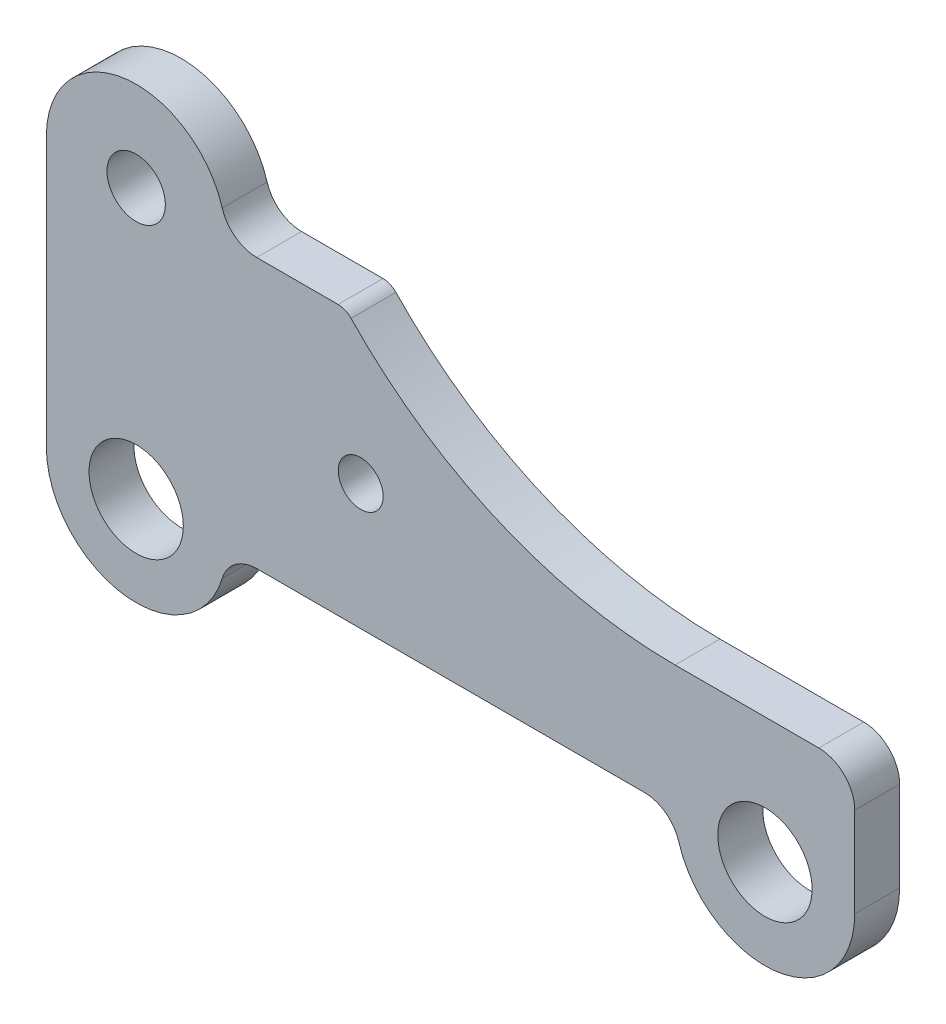
from build123d import *

# Parameters (mm, degrees)
SZKIC1_R                    = 3.25
SZKIC1_R_2                  = 5.25
SZKIC1_R_3                  = 2.5
DODANIE_WYCI_GNI_CIE1_DEPTH = 2.5
DODANIE_WYCI_GNI_CIE2_DEPTH = 0.5


with BuildPart() as part:
    # Szkic1 → Dodanie-wyciągnięcie1 (new, symmetric)
    with BuildSketch(Plane.XY):
        with BuildLine():
            Line((0, 40), (0, 10))
            ThreePointArc((0, 10), (8.556304179, 0.104761631), (19.583148475, 7.142857143))
            ThreePointArc((19.583148475, 7.142857143), (21.025950646, 9.207134903), (23.416407865, 10))
            Line((23.416407865, 10), (66.583592135, 10))
            ThreePointArc((66.583592135, 10), (68.974049354, 9.207134903), (70.416851525, 7.142857143))
            ThreePointArc((70.416851525, 7.142857143), (81.443695821, 0.104761631), (90, 10))
            Line((90, 10), (90, 20))
            ThreePointArc((90, 20), (88.828427125, 22.828427125), (86, 24))
            Line((86, 24), (70, 24))
            ThreePointArc((70, 24), (50.388386486, 28.00668945), (33.919878771, 39.384615385))
            ThreePointArc((33.919878771, 39.384615385), (33.261138462, 39.839732422), (32.476673921, 40))
            Line((32.476673921, 40), (23.416407865, 40))
            ThreePointArc((23.416407865, 40), (21.025950646, 40.792865097), (19.583148475, 42.857142857))
            ThreePointArc((19.583148475, 42.857142857), (8.556304179, 49.895238369), (0, 40))
        make_face()
        with Locations((10, 40)):
            Circle(SZKIC1_R, mode=Mode.SUBTRACT)
        with Locations((10, 10)):
            Circle(SZKIC1_R_2, mode=Mode.SUBTRACT)
        with Locations((80, 10)):
            Circle(SZKIC1_R_2, mode=Mode.SUBTRACT)
        with Locations((35, 24)):
            Circle(SZKIC1_R_3, mode=Mode.SUBTRACT)
    extrude(amount=DODANIE_WYCI_GNI_CIE1_DEPTH, both=True)

    # Szkic2 → Dodanie-wyciągnięcie2 (add)
    # profile 1 of 17: a face of its own
    with BuildSketch(Plane(origin=(0, 0, -2.5), x_dir=(-1, 0, 0), z_dir=(0, 0, -1))):
        with BuildLine():
            Line((-52.987940569, 19.766805223), (-52.92286704, 19.766805223))
            add(Edge.make_bspline(
                [(-52.92286704, 19.766805223), (-52.919415773, 19.766615337), (-52.913210356, 19.766273919), (-52.904593551, 19.763313829), (-52.898561403, 19.757474981), (-52.894202573, 19.748806282), (-52.893931804, 19.73544343), (-52.896111488, 19.71631196), (-52.901415728, 19.690119046), (-52.906686521, 19.670445503), (-52.909631746, 19.659452282)],
                knots=[0, 0, 0, 0, 0.651958994, 1.172229704, 1.679987062, 2.197675767, 2.964833836, 4.151233591, 5.849378804, 8, 8, 8, 8], degree=3))
            Line((-52.909631746, 19.659452282), (-53.017719981, 19.2572464))
            add(Edge.make_bspline(
                [(-53.017719981, 19.2572464), (-53.018671976, 19.25331729), (-53.020583374, 19.245428492), (-53.022838199, 19.237630897), (-53.023969981, 19.233716988)],
                knots=[0, 0, 0, 0, 0.996123973, 2, 2, 2, 2], degree=3))
            add(Edge.make_bspline(
                [(-53.023969981, 19.233716988), (-53.026355386, 19.226892456), (-53.030843045, 19.214053473), (-53.039991532, 19.197204931), (-53.048744321, 19.182779984), (-53.059593452, 19.172092385), (-53.071898984, 19.16371729), (-53.087182186, 19.158949317), (-53.104940193, 19.155509716), (-53.11782048, 19.155203954), (-53.124705275, 19.155040517)],
                knots=[0, 0, 0, 0, 1.234835229, 2.323094209, 3.277152647, 4.107706431, 4.910517855, 5.799407605, 6.82373532, 8, 8, 8, 8], degree=3))
            add(Edge.make_bspline(
                [(-53.124705275, 19.155040517), (-53.132966674, 19.155280143), (-53.147764778, 19.155709369), (-53.167484653, 19.161249751), (-53.182618394, 19.170262519), (-53.191943758, 19.185664995), (-53.194580035, 19.207549602), (-53.19414842, 19.237453972), (-53.190042014, 19.277358179), (-53.185627552, 19.30714717), (-53.183161157, 19.323790517)],
                knots=[0, 0, 0, 0, 0.912743282, 1.6349374, 2.252879968, 2.814495227, 3.560572029, 4.66097787, 6.134461705, 8, 8, 8, 8], degree=3))
            add(Edge.make_bspline(
                [(-53.183161157, 19.323790517), (-53.180201103, 19.345452223), (-53.174679917, 19.385856308), (-53.170832955, 19.442478309), (-53.171157127, 19.490613268), (-53.17579913, 19.530255715), (-53.184823386, 19.561727794), (-53.198736932, 19.584856397), (-53.218471776, 19.599831317), (-53.233780576, 19.601331439), (-53.24161704, 19.602099341)],
                knots=[0, 0, 0, 0, 1.676460648, 3.12698646, 4.349027505, 5.36331436, 6.18082896, 6.840449496, 7.406434534, 8, 8, 8, 8], degree=3))
            add(Edge.make_bspline(
                [(-53.24161704, 19.602099341), (-53.248458301, 19.601528454), (-53.262624267, 19.600346338), (-53.283050282, 19.590107001), (-53.302579358, 19.574288936), (-53.321423826, 19.552326478), (-53.339675071, 19.524425009), (-53.357517653, 19.49053316), (-53.374770373, 19.450522637), (-53.385055664, 19.42152996), (-53.390514099, 19.406143458)],
                knots=[0, 0, 0, 0, 0.630416796, 1.305382622, 2.072425111, 2.948465331, 3.970888085, 5.153204411, 6.489196893, 8, 8, 8, 8], degree=3))
            Line((-53.390514099, 19.406143458), (-53.868087628, 18.0009964))
            add(Edge.make_bspline(
                [(-53.868087628, 18.0009964), (-53.87163004, 17.99015639), (-53.878197772, 17.970058706), (-53.883926066, 17.941427487), (-53.885337105, 17.916984865), (-53.882873298, 17.896764979), (-53.875749984, 17.880371274), (-53.86360571, 17.86870573), (-53.847017425, 17.861836187), (-53.834703005, 17.861244345), (-53.828014099, 17.86092287)],
                knots=[0, 0, 0, 0, 1.548644482, 2.871230538, 3.954706057, 4.863680783, 5.616120211, 6.334438398, 7.095305703, 8, 8, 8, 8], degree=3))
            add(Edge.make_bspline(
                [(-53.828014099, 17.86092287), (-53.818710145, 17.861644132), (-53.799701339, 17.863117733), (-53.772285125, 17.8752516), (-53.745585634, 17.893795003), (-53.720133938, 17.920204152), (-53.694580426, 17.953059284), (-53.670748777, 17.993683735), (-53.646590289, 18.040985317), (-53.632290361, 18.075632997), (-53.624705275, 18.094011105)],
                knots=[0, 0, 0, 0, 0.683494468, 1.396440118, 2.175717535, 3.069970309, 4.087251777, 5.238317585, 6.535125694, 8, 8, 8, 8], degree=3))
            add(Edge.make_bspline(
                [(-53.624705275, 18.094011105), (-53.620367188, 18.104516496), (-53.612238407, 18.124201674), (-53.598003417, 18.150380691), (-53.583170039, 18.171448989), (-53.567437826, 18.188319736), (-53.548102966, 18.200406455), (-53.524584475, 18.208179739), (-53.496623338, 18.213380231), (-53.476326199, 18.213695895), (-53.465514099, 18.213864047)],
                knots=[0, 0, 0, 0, 1.253227141, 2.348318192, 3.278650201, 4.091230143, 4.875076549, 5.764432762, 6.809133776, 8, 8, 8, 8], degree=3))
            add(Edge.make_bspline(
                [(-53.465514099, 18.213864047), (-53.45752496, 18.213757909), (-53.44315485, 18.213566998), (-53.423918662, 18.209854921), (-53.409118649, 18.204479509), (-53.398352767, 18.195586818), (-53.393153451, 18.182481489), (-53.392508528, 18.165804742), (-53.396398733, 18.145178895), (-53.400890774, 18.130237653), (-53.403381746, 18.121952282)],
                knots=[0, 0, 0, 0, 1.308407976, 2.35344108, 3.201081133, 3.870709016, 4.57304945, 5.439792985, 6.580287725, 8, 8, 8, 8], degree=3))
            add(Edge.make_bspline(
                [(-53.403381746, 18.121952282), (-53.408594666, 18.10778842), (-53.418979255, 18.07957278), (-53.437644535, 18.038758047), (-53.459535463, 18.000065179), (-53.483921013, 17.963045257), (-53.511007423, 17.927834375), (-53.541123544, 17.894535938), (-53.573687053, 17.862961234), (-53.608919016, 17.833706782), (-53.645546662, 17.807207687), (-53.682980145, 17.783816292), (-53.720680441, 17.7637893), (-53.75921294, 17.74804211), (-53.798024993, 17.735413314), (-53.837205478, 17.726093), (-53.877016329, 17.720904449), (-53.903612774, 17.72013384), (-53.916984687, 17.7197464)],
                knots=[0, 0, 0, 0, 1.044397846, 2.080530978, 3.102119206, 4.118411817, 5.14652873, 6.17356041, 7.223317701, 8.283271519, 9.340302633, 10.349990107, 11.33643012, 12.290993217, 13.227139064, 14.159164209, 15.074481759, 16, 16, 16, 16], degree=3))
            add(Edge.make_bspline(
                [(-53.916984687, 17.7197464), (-53.929626953, 17.719966453), (-53.954272441, 17.720395435), (-53.990016253, 17.725531314), (-54.023740077, 17.73258152), (-54.055247951, 17.743274569), (-54.084282929, 17.757449241), (-54.11156036, 17.773937354), (-54.136185062, 17.794053576), (-54.158986402, 17.816940085), (-54.179172353, 17.844017909), (-54.196591334, 17.875360051), (-54.211865039, 17.910901015), (-54.22351694, 17.951032118), (-54.234155886, 17.995222193), (-54.241120438, 18.044093281), (-54.245756551, 18.097237881), (-54.248458324, 18.154639398), (-54.247858558, 18.216542021), (-54.242260346, 18.282648273), (-54.233634553, 18.353006542), (-54.220047964, 18.427397785), (-54.202746661, 18.505997469), (-54.181416907, 18.588809401), (-54.155437623, 18.675598574), (-54.136113101, 18.734617645), (-54.126175863, 18.764966988)],
                knots=[0, 0, 0, 0, 0.727989071, 1.419179644, 2.077208999, 2.711501386, 3.330632066, 3.936282737, 4.544029874, 5.158307725, 5.793935548, 6.483355827, 7.220604272, 8.018170158, 8.888439105, 9.838316756, 10.859457196, 11.962320712, 13.148910057, 14.424005062, 15.783556109, 17.232666391, 18.780070076, 20.421086893, 22.15961761, 24, 24, 24, 24], degree=3))
            add(Edge.make_bspline(
                [(-54.126175863, 18.764966988), (-54.116313814, 18.793588862), (-54.096997979, 18.84964774), (-54.065501874, 18.930747098), (-54.034021728, 19.007715694), (-54.001801684, 19.080313333), (-53.968184047, 19.148173221), (-53.934601124, 19.212096097), (-53.899544238, 19.271137828), (-53.864238762, 19.326300631), (-53.8278976, 19.377304143), (-53.792091991, 19.425642584), (-53.75553979, 19.470553052), (-53.718927681, 19.512424825), (-53.682042316, 19.5510973), (-53.645246346, 19.586914276), (-53.608231284, 19.619764621), (-53.570568758, 19.649030631), (-53.533276226, 19.675898007), (-53.495191641, 19.698337862), (-53.457753449, 19.718763359), (-53.419732793, 19.734539984), (-53.382137141, 19.748348962), (-53.344209327, 19.757470488), (-53.306454804, 19.76470486), (-53.281110929, 19.766105702), (-53.268455275, 19.766805223)],
                knots=[0, 0, 0, 0, 1.56970799, 3.074434128, 4.510652142, 5.881791242, 7.191976769, 8.437161262, 9.625133838, 10.751527077, 11.832324654, 12.871984577, 13.870429803, 14.834111984, 15.755570273, 16.640908586, 17.496390322, 18.320175579, 19.113595093, 19.877583345, 20.611015238, 21.3227907, 22.010176584, 22.685261588, 23.343475506, 24, 24, 24, 24], degree=3))
            add(Edge.make_bspline(
                [(-53.268455275, 19.766805223), (-53.254185827, 19.766284318), (-53.22708455, 19.765294987), (-53.18889626, 19.756710155), (-53.155131293, 19.742757938), (-53.136920231, 19.728044807), (-53.128014099, 19.720849341)],
                knots=[0, 0, 0, 0, 1.131602743, 2.149198575, 3.09486429, 4, 4, 4, 4], degree=3))
            add(Edge.make_bspline(
                [(-53.128014099, 19.720849341), (-53.122315712, 19.716032872), (-53.112745672, 19.707943952), (-53.100582064, 19.705353298), (-53.095661157, 19.704305223)],
                knots=[0, 0, 0, 0, 1.190880323, 2, 2, 2, 2], degree=3))
            add(Edge.make_bspline(
                [(-53.095661157, 19.704305223), (-53.092669489, 19.70490302), (-53.085295843, 19.706376426), (-53.073587603, 19.713595811), (-53.058586274, 19.723629927), (-53.048144434, 19.732482775), (-53.042352334, 19.737393458)],
                knots=[0, 0, 0, 0, 0.573751502, 1.41414075, 2.565621245, 4, 4, 4, 4], degree=3))
            add(Edge.make_bspline(
                [(-53.042352334, 19.737393458), (-53.037063333, 19.741832387), (-53.027336954, 19.749995498), (-53.012691944, 19.759027765), (-52.999956846, 19.765450708), (-52.991670163, 19.766384811), (-52.987940569, 19.766805223)],
                knots=[0, 0, 0, 0, 1.315396407, 2.418990612, 3.288433867, 4, 4, 4, 4], degree=3))
        make_face()
    # profile 2 of 17: a face of its own
    with BuildSketch(Plane(origin=(0, 0, -2.5), x_dir=(-1, 0, 0), z_dir=(0, 0, -1))):
        with BuildLine():
            Line((-52.418455275, 18.943275811), (-52.333528805, 19.192908164))
            add(Edge.make_bspline(
                [(-52.333528805, 19.192908164), (-52.331054134, 19.200949032), (-52.326494291, 19.215765185), (-52.322259177, 19.236867734), (-52.322629854, 19.254973055), (-52.325796779, 19.270240316), (-52.333753839, 19.282081058), (-52.345211692, 19.29062347), (-52.36034089, 19.295733536), (-52.371599816, 19.296048068), (-52.377646452, 19.296216988)],
                knots=[0, 0, 0, 0, 1.446700267, 2.66569884, 3.677001357, 4.54550188, 5.304983555, 6.071733163, 6.964419298, 8, 8, 8, 8], degree=3))
            add(Edge.make_bspline(
                [(-52.377646452, 19.296216988), (-52.386523565, 19.29585717), (-52.403839259, 19.29515531), (-52.428813104, 19.287698256), (-52.451805586, 19.275901852), (-52.472680713, 19.259122837), (-52.492135885, 19.238252803), (-52.509194879, 19.212299134), (-52.524240302, 19.181791609), (-52.532504977, 19.15965832), (-52.536837628, 19.148055223)],
                knots=[0, 0, 0, 0, 0.909725935, 1.774511163, 2.653029052, 3.549765758, 4.512002083, 5.573647726, 6.728015471, 8, 8, 8, 8], degree=3))
            add(Edge.make_bspline(
                [(-52.536837628, 19.148055223), (-52.541440842, 19.135120034), (-52.550054105, 19.110916467), (-52.564698256, 19.078036785), (-52.579647021, 19.050964247), (-52.595444222, 19.028702135), (-52.614967891, 19.010566213), (-52.639198214, 18.995135211), (-52.668539995, 18.980233037), (-52.702713317, 18.967728768), (-52.739263134, 18.956786627), (-52.776912492, 18.949081004), (-52.814518704, 18.94405624), (-52.839763166, 18.943534486), (-52.852278805, 18.943275811)],
                knots=[0, 0, 0, 0, 1.205720605, 2.256073711, 3.157339841, 3.919494122, 4.642961723, 5.481902753, 6.435093392, 7.528684399, 8.673169427, 9.783636457, 10.901176596, 12, 12, 12, 12], degree=3))
            add(Edge.make_bspline(
                [(-52.852278805, 18.943275811), (-52.864092088, 18.943674142), (-52.885819126, 18.944406753), (-52.915384816, 18.951919635), (-52.938863064, 18.965006805), (-52.955558991, 18.984217979), (-52.96436725, 19.00896149), (-52.966637438, 19.038240614), (-52.961559114, 19.072287508), (-52.954339454, 19.095942442), (-52.950440569, 19.108716988)],
                knots=[0, 0, 0, 0, 1.168698085, 2.149474194, 2.992863868, 3.793572157, 4.612124704, 5.550891187, 6.677390029, 8, 8, 8, 8], degree=3))
            add(Edge.make_bspline(
                [(-52.950440569, 19.108716988), (-52.945663557, 19.121444636), (-52.936087815, 19.146957794), (-52.917242853, 19.183338951), (-52.89449917, 19.217794497), (-52.868370642, 19.250605243), (-52.838408831, 19.281566382), (-52.804786824, 19.31066266), (-52.767505178, 19.337919696), (-52.72681786, 19.36297973), (-52.683776974, 19.386224444), (-52.6385008, 19.405835379), (-52.591901814, 19.422943531), (-52.543663097, 19.437000446), (-52.493722249, 19.447467339), (-52.442297195, 19.455215015), (-52.389387098, 19.460195523), (-52.353515446, 19.460678513), (-52.33536704, 19.46092287)],
                knots=[0, 0, 0, 0, 0.864699893, 1.733330898, 2.600840546, 3.488866118, 4.399052184, 5.338997699, 6.315607195, 7.335040511, 8.378392971, 9.42616767, 10.472402526, 11.536311081, 12.620947074, 13.71743767, 14.84519212, 16, 16, 16, 16], degree=3))
            add(Edge.make_bspline(
                [(-52.33536704, 19.46092287), (-52.31205969, 19.460465133), (-52.267023973, 19.45958067), (-52.202164491, 19.451808166), (-52.142603545, 19.439179816), (-52.096917047, 19.423923066), (-52.063506053, 19.409409423), (-52.041150985, 19.396307654), (-52.020986363, 19.381489563), (-52.00222666, 19.365501537), (-51.986552248, 19.34686342), (-51.972780124, 19.326779419), (-51.960908626, 19.305033295), (-51.948397178, 19.273605317), (-51.937368059, 19.231773076), (-51.933705024, 19.178810928), (-51.937887204, 19.123405532), (-51.947625272, 19.086788684), (-51.952646452, 19.067908164)],
                knots=[0, 0, 0, 0, 1.669878932, 3.226630091, 4.673700838, 6.026292539, 6.671041919, 7.281120111, 7.878420379, 8.463389055, 9.042593045, 9.61751945, 10.207020033, 10.813738284, 12.03862703, 13.289532086, 14.602418097, 16, 16, 16, 16], degree=3))
            Line((-51.952646452, 19.067908164), (-52.349705275, 17.899158164))
            add(Edge.make_bspline(
                [(-52.349705275, 17.899158164), (-52.349171735, 17.897283858), (-52.347711615, 17.892154514), (-52.341605242, 17.884013964), (-52.33222124, 17.87331133), (-52.324628085, 17.865424875), (-52.32029351, 17.86092287)],
                knots=[0, 0, 0, 0, 0.4773604, 1.306374769, 2.462336269, 4, 4, 4, 4], degree=3))
            add(Edge.make_bspline(
                [(-52.32029351, 17.86092287), (-52.316882265, 17.858455132), (-52.310377462, 17.853749474), (-52.304322128, 17.842991578), (-52.303502787, 17.830479578), (-52.305582305, 17.822278743), (-52.306690569, 17.817908164)],
                knots=[0, 0, 0, 0, 1.018502278, 1.942151773, 2.903284069, 4, 4, 4, 4], degree=3))
            add(Edge.make_bspline(
                [(-52.306690569, 17.817908164), (-52.30890119, 17.811857466), (-52.313049459, 17.800503221), (-52.320673578, 17.785135071), (-52.329637279, 17.772846776), (-52.339721675, 17.762515807), (-52.352894501, 17.753861051), (-52.370653867, 17.746960069), (-52.39296489, 17.739636028), (-52.419962624, 17.732757988), (-52.450907476, 17.727030329), (-52.485138758, 17.722608531), (-52.522337427, 17.720053585), (-52.548108104, 17.719851288), (-52.561469981, 17.7197464)],
                knots=[0, 0, 0, 0, 0.790244274, 1.482907626, 2.096467061, 2.649355955, 3.245723337, 4.013768149, 4.979042636, 6.127842478, 7.428399348, 8.838395921, 10.3607352, 12, 12, 12, 12], degree=3))
            add(Edge.make_bspline(
                [(-52.561469981, 17.7197464), (-52.577307177, 17.720108129), (-52.607298121, 17.720793137), (-52.649506238, 17.727481356), (-52.686329694, 17.737820915), (-52.718009161, 17.752808639), (-52.744435335, 17.774819821), (-52.761833092, 17.806518311), (-52.773881697, 17.845128522), (-52.775612228, 17.873801413), (-52.77654351, 17.889231694)],
                knots=[0, 0, 0, 0, 1.206082389, 2.28396167, 3.247412685, 4.11199913, 4.939628341, 5.818969459, 6.826281153, 8, 8, 8, 8], degree=3))
            add(Edge.make_bspline(
                [(-52.77654351, 17.889231694), (-52.78815898, 17.880495579), (-52.810510621, 17.863684678), (-52.843232638, 17.839960171), (-52.874167709, 17.819310648), (-52.902469924, 17.800088048), (-52.929150216, 17.784206443), (-52.953621286, 17.770388152), (-52.975867741, 17.758922443), (-53.002580788, 17.747320094), (-53.034120164, 17.736263439), (-53.071330249, 17.727133794), (-53.107575019, 17.720761134), (-53.131665037, 17.720079841), (-53.143455275, 17.7197464)],
                knots=[0, 0, 0, 0, 1.27068392, 2.445176448, 3.532794046, 4.522318982, 5.435527675, 6.246189969, 6.979297925, 7.622228069, 8.791234573, 9.895609904, 10.970060504, 12, 12, 12, 12], degree=3))
            add(Edge.make_bspline(
                [(-53.143455275, 17.7197464), (-53.155495154, 17.720027821), (-53.178630064, 17.720568578), (-53.211604307, 17.726657857), (-53.241514428, 17.735975641), (-53.267928851, 17.749940131), (-53.291578717, 17.767135103), (-53.311124193, 17.789117914), (-53.328024067, 17.81429758), (-53.340842971, 17.843947165), (-53.35013191, 17.877810149), (-53.354614439, 17.916549044), (-53.354744956, 17.960029632), (-53.35047904, 18.008340754), (-53.34178667, 18.061486061), (-53.328772777, 18.11950539), (-53.311455872, 18.182441913), (-53.297208095, 18.225567848), (-53.289778805, 18.248055223)],
                knots=[0, 0, 0, 0, 0.869961613, 1.671651667, 2.41741909, 3.127223202, 3.824063806, 4.520622369, 5.243538079, 6.00958168, 6.846245217, 7.775445914, 8.821627565, 9.98711205, 11.279944339, 12.714670292, 14.28691384, 16, 16, 16, 16], degree=3))
            add(Edge.make_bspline(
                [(-53.289778805, 18.248055223), (-53.281763014, 18.270678366), (-53.266274869, 18.314390903), (-53.240659131, 18.376548832), (-53.21522853, 18.433667846), (-53.188716565, 18.48514387), (-53.161933887, 18.531434884), (-53.134437089, 18.572230567), (-53.106592011, 18.60791257), (-53.077043674, 18.638594357), (-53.044705387, 18.666121022), (-53.008569799, 18.692446331), (-52.968110138, 18.718549106), (-52.923057893, 18.743954392), (-52.873240126, 18.768480024), (-52.818843651, 18.792591316), (-52.760076063, 18.816617183), (-52.719006361, 18.831304314), (-52.69786704, 18.838864047)],
                knots=[0, 0, 0, 0, 1.309362686, 2.529956373, 3.667170571, 4.719838253, 5.687757351, 6.583512722, 7.402232678, 8.154141199, 8.903339271, 9.716469882, 10.5919044, 11.529102946, 12.536852002, 13.620411966, 14.775182825, 16, 16, 16, 16], degree=3))
            add(Edge.make_bspline(
                [(-52.69786704, 18.838864047), (-52.671240268, 18.848083891), (-52.62006626, 18.865803516), (-52.546995852, 18.89278699), (-52.480295547, 18.91790149), (-52.438394043, 18.93509453), (-52.418455275, 18.943275811)],
                knots=[0, 0, 0, 0, 1.133395099, 2.178272705, 3.133133807, 4, 4, 4, 4], degree=3))
        make_face()
        with BuildLine():
            add(Edge.make_bspline(
                [(-52.473234687, 18.7822464), (-52.485788672, 18.777100571), (-52.510162054, 18.767110018), (-52.544514485, 18.750643894), (-52.575740197, 18.733664099), (-52.603604777, 18.716089235), (-52.628402582, 18.698145225), (-52.649800947, 18.679588148), (-52.668548647, 18.661085755), (-52.683930295, 18.640271893), (-52.698326809, 18.616414573), (-52.713377742, 18.587541055), (-52.729393665, 18.552451621), (-52.746911541, 18.511332099), (-52.76612657, 18.464227126), (-52.786259313, 18.410869899), (-52.807505915, 18.351232918), (-52.821927531, 18.309343944), (-52.829484687, 18.287393458)],
                knots=[0, 0, 0, 0, 1.017809923, 1.976063327, 2.856660906, 3.683176676, 4.446406047, 5.15051918, 5.807228418, 6.417770373, 7.086408577, 7.896653268, 8.859308006, 9.97972437, 11.250081055, 12.676026808, 14.258185349, 16, 16, 16, 16], degree=3))
            add(Edge.make_bspline(
                [(-52.829484687, 18.287393458), (-52.834977989, 18.271372111), (-52.84542507, 18.240902949), (-52.858713773, 18.197094486), (-52.870793769, 18.158283183), (-52.879911531, 18.124021963), (-52.887076225, 18.094509912), (-52.891915935, 18.06961454), (-52.894731489, 18.049231032), (-52.895473007, 18.029275502), (-52.891963349, 18.00922372), (-52.880080985, 17.990827581), (-52.860908458, 17.979784809), (-52.846307468, 17.97899993), (-52.838308216, 17.978569929)],
                knots=[0, 0, 0, 0, 1.731879654, 3.293663276, 4.681314654, 5.888207414, 6.918689875, 7.786328447, 8.481172056, 9.020212065, 9.82638902, 10.521571605, 11.190032909, 12, 12, 12, 12], degree=3))
            add(Edge.make_bspline(
                [(-52.838308216, 17.978569929), (-52.830772054, 17.979087219), (-52.815705728, 17.980121388), (-52.793813775, 17.987934655), (-52.773262045, 18.000700338), (-52.754383638, 18.01906518), (-52.736437432, 18.041910629), (-52.719861769, 18.069867857), (-52.705019103, 18.102842609), (-52.696242702, 18.126672165), (-52.69161704, 18.139231694)],
                knots=[0, 0, 0, 0, 0.778291724, 1.555963872, 2.375582501, 3.263333651, 4.265034308, 5.373704714, 6.61579335, 8, 8, 8, 8], degree=3))
            Line((-52.69161704, 18.139231694), (-52.473234687, 18.7822464))
        make_face(mode=Mode.SUBTRACT)
    # profile 3 of 17: a face of its own
    with BuildSketch(Plane(origin=(0, 0, -2.5), x_dir=(-1, 0, 0), z_dir=(0, 0, -1))):
        with BuildLine():
            add(Edge.make_bspline(
                [(-51.227278805, 19.262761105), (-51.209583324, 19.278436435), (-51.17518788, 19.308905227), (-51.122031977, 19.349274797), (-51.069516319, 19.383370722), (-51.018031054, 19.411586393), (-50.967107722, 19.433596846), (-50.916905345, 19.448934315), (-50.867538819, 19.459381083), (-50.834682487, 19.460413149), (-50.818455275, 19.46092287)],
                knots=[0, 0, 0, 0, 1.221035862, 2.373378406, 3.444648934, 4.453240276, 5.403486282, 6.304690827, 7.162714201, 8, 8, 8, 8], degree=3))
            add(Edge.make_bspline(
                [(-50.818455275, 19.46092287), (-50.808763532, 19.460596719), (-50.790165431, 19.459970848), (-50.763351637, 19.4564339), (-50.738814817, 19.44986753), (-50.716788987, 19.440211983), (-50.696752704, 19.428405214), (-50.679434047, 19.413436933), (-50.664126769, 19.396107656), (-50.651847259, 19.376016518), (-50.641406644, 19.354438845), (-50.634030891, 19.331032148), (-50.62978882, 19.306303394), (-50.627825883, 19.280185282), (-50.629133126, 19.252846737), (-50.632873563, 19.224064193), (-50.639432573, 19.194018616), (-50.645973685, 19.173862316), (-50.649337628, 19.1634964)],
                knots=[0, 0, 0, 0, 1.119421817, 2.148129761, 3.116259622, 4.041659712, 4.917813008, 5.791219017, 6.673862848, 7.576918622, 8.501127651, 9.436537012, 10.39979327, 11.392940891, 12.455172231, 13.554009374, 14.742083771, 16, 16, 16, 16], degree=3))
            Line((-50.649337628, 19.1634964), (-51.05779351, 17.962025811))
            add(Edge.make_bspline(
                [(-51.05779351, 17.962025811), (-51.059509518, 17.955832154), (-51.062708899, 17.944284493), (-51.061789296, 17.926790631), (-51.054873367, 17.911282578), (-51.046376908, 17.904259377), (-51.041984687, 17.900628752)],
                knots=[0, 0, 0, 0, 1.120829324, 2.089711349, 3.012481653, 4, 4, 4, 4], degree=3))
            add(Edge.make_bspline(
                [(-51.041984687, 17.900628752), (-51.037829862, 17.897140705), (-51.028885522, 17.889631778), (-51.024981648, 17.869493219), (-51.027605266, 17.845010769), (-51.033254542, 17.827270327), (-51.036469981, 17.81717287)],
                knots=[0, 0, 0, 0, 0.706656124, 1.521260987, 2.589158082, 4, 4, 4, 4], degree=3))
            add(Edge.make_bspline(
                [(-51.036469981, 17.81717287), (-51.039303418, 17.809166605), (-51.044370668, 17.794848389), (-51.052499302, 17.776290348), (-51.05953197, 17.762711389), (-51.069083179, 17.750716386), (-51.08790152, 17.74411861), (-51.103251742, 17.743586299), (-51.112205275, 17.743275811)],
                knots=[0, 0, 0, 0, 1.299602892, 2.324179003, 3.096606526, 3.641828274, 4.624517038, 6, 6, 6, 6], degree=3))
            Line((-51.112205275, 17.743275811), (-51.477646452, 17.743275811))
            add(Edge.make_bspline(
                [(-51.477646452, 17.743275811), (-51.48188511, 17.74916188), (-51.490263503, 17.760796646), (-51.49938365, 17.78028057), (-51.506011457, 17.800535612), (-51.510166488, 17.821643708), (-51.51124303, 17.843676206), (-51.509180049, 17.866590235), (-51.504857588, 17.890509293), (-51.499994442, 17.90643078), (-51.497499393, 17.914599341)],
                knots=[0, 0, 0, 0, 0.965073396, 1.907623678, 2.853001052, 3.801337802, 4.766411198, 5.782535867, 6.862324254, 8, 8, 8, 8], degree=3))
            Line((-51.497499393, 17.914599341), (-51.100440569, 19.082614047))
            add(Edge.make_bspline(
                [(-51.100440569, 19.082614047), (-51.098007905, 19.090031914), (-51.093525068, 19.103701331), (-51.09051818, 19.123432978), (-51.090436807, 19.140349796), (-51.094343147, 19.154558507), (-51.10227237, 19.165578247), (-51.113494626, 19.173727409), (-51.128485697, 19.177869322), (-51.13939014, 19.178323856), (-51.14529351, 19.178569929)],
                knots=[0, 0, 0, 0, 1.413350396, 2.604478289, 3.604732302, 4.462527708, 5.227184293, 6.022857244, 6.929628408, 8, 8, 8, 8], degree=3))
            add(Edge.make_bspline(
                [(-51.14529351, 19.178569929), (-51.154439721, 19.177853128), (-51.174333336, 19.17629404), (-51.205203048, 19.164730552), (-51.239385275, 19.147364498), (-51.262362204, 19.132028777), (-51.274705275, 19.123790517)],
                knots=[0, 0, 0, 0, 0.769910871, 1.67460725, 2.750812663, 4, 4, 4, 4], degree=3))
            Line((-51.274705275, 19.123790517), (-51.669558216, 17.961658164))
            add(Edge.make_bspline(
                [(-51.669558216, 17.961658164), (-51.671510724, 17.954607888), (-51.675119741, 17.941576154), (-51.673180428, 17.921721932), (-51.664858521, 17.903996789), (-51.654654323, 17.895981454), (-51.649337628, 17.891805223)],
                knots=[0, 0, 0, 0, 1.106781708, 2.045775826, 2.981790185, 4, 4, 4, 4], degree=3))
            add(Edge.make_bspline(
                [(-51.649337628, 17.891805223), (-51.646095964, 17.889225798), (-51.639703381, 17.884139155), (-51.635098843, 17.871575346), (-51.635618544, 17.856842774), (-51.638543413, 17.846654072), (-51.640146452, 17.841069929)],
                knots=[0, 0, 0, 0, 0.875644589, 1.726776707, 2.754109938, 4, 4, 4, 4], degree=3))
            Line((-51.640146452, 17.841069929), (-51.659999393, 17.7822464))
            add(Edge.make_bspline(
                [(-51.659999393, 17.7822464), (-51.662732865, 17.776264304), (-51.668270368, 17.764145697), (-51.685948299, 17.751620963), (-51.70895029, 17.744429812), (-51.726229925, 17.743685322), (-51.735734687, 17.743275811)],
                knots=[0, 0, 0, 0, 0.853604938, 1.729243961, 2.75095764, 4, 4, 4, 4], degree=3))
            Line((-51.735734687, 17.743275811), (-52.187205275, 17.743275811))
            add(Edge.make_bspline(
                [(-52.187205275, 17.743275811), (-52.192116767, 17.743235194), (-52.200882653, 17.743162701), (-52.212361897, 17.745130109), (-52.220723875, 17.747305192), (-52.226875585, 17.75130197), (-52.2285032, 17.758703099), (-52.227706996, 17.767992686), (-52.225030261, 17.780483393), (-52.221991547, 17.789633379), (-52.22029351, 17.7947464)],
                knots=[0, 0, 0, 0, 1.38353889, 2.469299702, 3.267587167, 3.834703095, 4.414330439, 5.279463427, 6.479761831, 8, 8, 8, 8], degree=3))
            Line((-52.22029351, 17.7947464), (-52.205955275, 17.837393458))
            add(Edge.make_bspline(
                [(-52.205955275, 17.837393458), (-52.203940664, 17.842633457), (-52.20001849, 17.852835022), (-52.191158607, 17.866123581), (-52.1801323, 17.876970996), (-52.171403882, 17.881937661), (-52.166984687, 17.884452282)],
                knots=[0, 0, 0, 0, 1.071307506, 2.085690179, 3.030785435, 4, 4, 4, 4], degree=3))
            add(Edge.make_bspline(
                [(-52.166984687, 17.884452282), (-52.156209077, 17.890939727), (-52.137337619, 17.902301271), (-52.116956894, 17.920385245), (-52.10541643, 17.938054884), (-52.097042194, 17.956309708), (-52.086950484, 17.979704445), (-52.080935544, 17.997509972), (-52.077646452, 18.0072464)],
                knots=[0, 0, 0, 0, 1.441269281, 2.524112632, 3.081111184, 3.847376419, 4.822901329, 6, 6, 6, 6], degree=3))
            Line((-52.077646452, 18.0072464), (-51.661469981, 19.2322464))
            add(Edge.make_bspline(
                [(-51.661469981, 19.2322464), (-51.659655016, 19.239043007), (-51.656333209, 19.251482372), (-51.658322543, 19.270504089), (-51.668377693, 19.286427442), (-51.679007194, 19.292829414), (-51.684631746, 19.296216988)],
                knots=[0, 0, 0, 0, 1.11557212, 2.041755418, 2.96380395, 4, 4, 4, 4], degree=3))
            add(Edge.make_bspline(
                [(-51.684631746, 19.296216988), (-51.687787892, 19.298190082), (-51.693867143, 19.301990584), (-51.699413741, 19.311606853), (-51.700379119, 19.323264926), (-51.698049645, 19.330947734), (-51.696764099, 19.335187576)],
                knots=[0, 0, 0, 0, 0.976862256, 1.881595867, 2.830935337, 4, 4, 4, 4], degree=3))
            Line((-51.696764099, 19.335187576), (-51.675072922, 19.399525811))
            add(Edge.make_bspline(
                [(-51.675072922, 19.399525811), (-51.672870765, 19.405265072), (-51.668723453, 19.416073797), (-51.65698231, 19.428279579), (-51.64265924, 19.436539967), (-51.631808402, 19.437101812), (-51.626175863, 19.437393458)],
                knots=[0, 0, 0, 0, 1.097554239, 2.067018915, 2.996613043, 4, 4, 4, 4], degree=3))
            Line((-51.626175863, 19.437393458), (-51.20779351, 19.437393458))
            add(Edge.make_bspline(
                [(-51.20779351, 19.437393458), (-51.203740909, 19.437388395), (-51.196701678, 19.4373796), (-51.187507123, 19.435963692), (-51.180985472, 19.433737746), (-51.175103039, 19.428118562), (-51.176081167, 19.414265072), (-51.179502626, 19.404153617), (-51.181690569, 19.397687576)],
                knots=[0, 0, 0, 0, 1.115326476, 1.937284456, 2.55836384, 2.988341874, 4.074114589, 6, 6, 6, 6], degree=3))
            Line((-51.181690569, 19.397687576), (-51.227278805, 19.262761105))
        make_face()
    # profile 4 of 17: a face of its own
    with BuildSketch(Plane(origin=(0, 0, -2.5), x_dir=(-1, 0, 0), z_dir=(0, 0, -1))):
        with BuildLine():
            add(Edge.make_bspline(
                [(-49.980219981, 19.262761105), (-49.962524501, 19.278436435), (-49.928129056, 19.308905227), (-49.874973154, 19.349274797), (-49.822457496, 19.383370722), (-49.770972231, 19.411586393), (-49.720048898, 19.433596846), (-49.669846521, 19.448934315), (-49.620479996, 19.459381083), (-49.587623663, 19.460413149), (-49.571396452, 19.46092287)],
                knots=[0, 0, 0, 0, 1.221035862, 2.373378406, 3.444648934, 4.453240276, 5.403486282, 6.304690827, 7.162714201, 8, 8, 8, 8], degree=3))
            add(Edge.make_bspline(
                [(-49.571396452, 19.46092287), (-49.561704709, 19.460596719), (-49.543106607, 19.459970848), (-49.516292813, 19.4564339), (-49.491755993, 19.44986753), (-49.469730163, 19.440211983), (-49.449693881, 19.428405214), (-49.432375224, 19.413436933), (-49.417067946, 19.396107656), (-49.404788436, 19.376016518), (-49.394347821, 19.354438845), (-49.386972067, 19.331032148), (-49.382729996, 19.306303394), (-49.380767059, 19.280185282), (-49.382074302, 19.252846737), (-49.38581474, 19.224064193), (-49.392373749, 19.194018616), (-49.398914862, 19.173862316), (-49.402278805, 19.1634964)],
                knots=[0, 0, 0, 0, 1.119421817, 2.148129761, 3.116259622, 4.041659712, 4.917813008, 5.791219017, 6.673862848, 7.576918622, 8.501127651, 9.436537012, 10.39979327, 11.392940891, 12.455172231, 13.554009374, 14.742083771, 16, 16, 16, 16], degree=3))
            Line((-49.402278805, 19.1634964), (-49.810734687, 17.962025811))
            add(Edge.make_bspline(
                [(-49.810734687, 17.962025811), (-49.812450694, 17.955832154), (-49.815650076, 17.944284493), (-49.814730472, 17.926790631), (-49.807814543, 17.911282578), (-49.799318084, 17.904259377), (-49.794925863, 17.900628752)],
                knots=[0, 0, 0, 0, 1.120829324, 2.089711349, 3.012481653, 4, 4, 4, 4], degree=3))
            add(Edge.make_bspline(
                [(-49.794925863, 17.900628752), (-49.790771039, 17.897140705), (-49.781826699, 17.889631778), (-49.777922825, 17.869493219), (-49.780546442, 17.845010769), (-49.786195718, 17.827270327), (-49.789411157, 17.81717287)],
                knots=[0, 0, 0, 0, 0.706656124, 1.521260987, 2.589158082, 4, 4, 4, 4], degree=3))
            add(Edge.make_bspline(
                [(-49.789411157, 17.81717287), (-49.792244594, 17.809166605), (-49.797311845, 17.794848389), (-49.805440478, 17.776290348), (-49.812473146, 17.762711389), (-49.822024355, 17.750716386), (-49.840842696, 17.74411861), (-49.856192918, 17.743586299), (-49.865146452, 17.743275811)],
                knots=[0, 0, 0, 0, 1.299602892, 2.324179003, 3.096606526, 3.641828274, 4.624517038, 6, 6, 6, 6], degree=3))
            Line((-49.865146452, 17.743275811), (-50.230587628, 17.743275811))
            add(Edge.make_bspline(
                [(-50.230587628, 17.743275811), (-50.234826286, 17.74916188), (-50.243204679, 17.760796646), (-50.252324827, 17.78028057), (-50.258952633, 17.800535612), (-50.263107665, 17.821643708), (-50.264184207, 17.843676206), (-50.262121226, 17.866590235), (-50.257798764, 17.890509293), (-50.252935619, 17.90643078), (-50.250440569, 17.914599341)],
                knots=[0, 0, 0, 0, 0.965073396, 1.907623678, 2.853001052, 3.801337802, 4.766411198, 5.782535867, 6.862324254, 8, 8, 8, 8], degree=3))
            Line((-50.250440569, 17.914599341), (-49.853381746, 19.082614047))
            add(Edge.make_bspline(
                [(-49.853381746, 19.082614047), (-49.850949082, 19.090031914), (-49.846466245, 19.103701331), (-49.843459357, 19.123432978), (-49.843377984, 19.140349796), (-49.847284323, 19.154558507), (-49.855213547, 19.165578247), (-49.866435803, 19.173727409), (-49.881426874, 19.177869322), (-49.892331317, 19.178323856), (-49.898234687, 19.178569929)],
                knots=[0, 0, 0, 0, 1.413350396, 2.604478289, 3.604732302, 4.462527708, 5.227184293, 6.022857244, 6.929628408, 8, 8, 8, 8], degree=3))
            add(Edge.make_bspline(
                [(-49.898234687, 19.178569929), (-49.907380897, 19.177853128), (-49.927274512, 19.17629404), (-49.958144224, 19.164730552), (-49.992326452, 19.147364498), (-50.01530338, 19.132028777), (-50.027646452, 19.123790517)],
                knots=[0, 0, 0, 0, 0.769910871, 1.67460725, 2.750812663, 4, 4, 4, 4], degree=3))
            Line((-50.027646452, 19.123790517), (-50.422499393, 17.961658164))
            add(Edge.make_bspline(
                [(-50.422499393, 17.961658164), (-50.424451901, 17.954607888), (-50.428060918, 17.941576154), (-50.426121604, 17.921721932), (-50.417799698, 17.903996789), (-50.4075955, 17.895981454), (-50.402278805, 17.891805223)],
                knots=[0, 0, 0, 0, 1.106781708, 2.045775826, 2.981790185, 4, 4, 4, 4], degree=3))
            add(Edge.make_bspline(
                [(-50.402278805, 17.891805223), (-50.39903714, 17.889225798), (-50.392644557, 17.884139155), (-50.388040019, 17.871575346), (-50.388559721, 17.856842774), (-50.391484589, 17.846654072), (-50.393087628, 17.841069929)],
                knots=[0, 0, 0, 0, 0.875644589, 1.726776707, 2.754109938, 4, 4, 4, 4], degree=3))
            Line((-50.393087628, 17.841069929), (-50.412940569, 17.7822464))
            add(Edge.make_bspline(
                [(-50.412940569, 17.7822464), (-50.415674041, 17.776264304), (-50.421211544, 17.764145697), (-50.438889475, 17.751620963), (-50.461891466, 17.744429812), (-50.479171101, 17.743685322), (-50.488675863, 17.743275811)],
                knots=[0, 0, 0, 0, 0.853604938, 1.729243961, 2.75095764, 4, 4, 4, 4], degree=3))
            Line((-50.488675863, 17.743275811), (-50.940146452, 17.743275811))
            add(Edge.make_bspline(
                [(-50.940146452, 17.743275811), (-50.945057943, 17.743235194), (-50.953823829, 17.743162701), (-50.965303074, 17.745130109), (-50.973665052, 17.747305192), (-50.979816762, 17.75130197), (-50.981444377, 17.758703099), (-50.980648173, 17.767992686), (-50.977971437, 17.780483393), (-50.974932723, 17.789633379), (-50.973234687, 17.7947464)],
                knots=[0, 0, 0, 0, 1.38353889, 2.469299702, 3.267587167, 3.834703095, 4.414330439, 5.279463427, 6.479761831, 8, 8, 8, 8], degree=3))
            Line((-50.973234687, 17.7947464), (-50.958896452, 17.837393458))
            add(Edge.make_bspline(
                [(-50.958896452, 17.837393458), (-50.956881841, 17.842633457), (-50.952959667, 17.852835022), (-50.944099784, 17.866123581), (-50.933073477, 17.876970996), (-50.924345059, 17.881937661), (-50.919925863, 17.884452282)],
                knots=[0, 0, 0, 0, 1.071307506, 2.085690179, 3.030785435, 4, 4, 4, 4], degree=3))
            add(Edge.make_bspline(
                [(-50.919925863, 17.884452282), (-50.909150254, 17.890939727), (-50.890278796, 17.902301271), (-50.869898071, 17.920385245), (-50.858357606, 17.938054884), (-50.84998337, 17.956309708), (-50.839891661, 17.979704445), (-50.833876721, 17.997509972), (-50.830587628, 18.0072464)],
                knots=[0, 0, 0, 0, 1.441269281, 2.524112632, 3.081111184, 3.847376419, 4.822901329, 6, 6, 6, 6], degree=3))
            Line((-50.830587628, 18.0072464), (-50.414411157, 19.2322464))
            add(Edge.make_bspline(
                [(-50.414411157, 19.2322464), (-50.412596192, 19.239043007), (-50.409274386, 19.251482372), (-50.411263719, 19.270504089), (-50.421318869, 19.286427442), (-50.431948371, 19.292829414), (-50.437572922, 19.296216988)],
                knots=[0, 0, 0, 0, 1.11557212, 2.041755418, 2.96380395, 4, 4, 4, 4], degree=3))
            add(Edge.make_bspline(
                [(-50.437572922, 19.296216988), (-50.440729068, 19.298190082), (-50.446808319, 19.301990584), (-50.452354917, 19.311606853), (-50.453320296, 19.323264926), (-50.450990821, 19.330947734), (-50.449705275, 19.335187576)],
                knots=[0, 0, 0, 0, 0.976862256, 1.881595867, 2.830935337, 4, 4, 4, 4], degree=3))
            Line((-50.449705275, 19.335187576), (-50.428014099, 19.399525811))
            add(Edge.make_bspline(
                [(-50.428014099, 19.399525811), (-50.425811942, 19.405265072), (-50.421664629, 19.416073797), (-50.409923486, 19.428279579), (-50.395600417, 19.436539967), (-50.384749578, 19.437101812), (-50.37911704, 19.437393458)],
                knots=[0, 0, 0, 0, 1.097554239, 2.067018915, 2.996613043, 4, 4, 4, 4], degree=3))
            Line((-50.37911704, 19.437393458), (-49.960734687, 19.437393458))
            add(Edge.make_bspline(
                [(-49.960734687, 19.437393458), (-49.956682086, 19.437388395), (-49.949642854, 19.4373796), (-49.940448299, 19.435963692), (-49.933926648, 19.433737746), (-49.928044215, 19.428118562), (-49.929022343, 19.414265072), (-49.932443802, 19.404153617), (-49.934631746, 19.397687576)],
                knots=[0, 0, 0, 0, 1.115326476, 1.937284456, 2.55836384, 2.988341874, 4.074114589, 6, 6, 6, 6], degree=3))
            Line((-49.934631746, 19.397687576), (-49.980219981, 19.262761105))
        make_face()
    # profile 5 of 17: a face of its own
    with BuildSketch(Plane(origin=(0, 0, -2.5), x_dir=(-1, 0, 0), z_dir=(0, 0, -1))):
        with BuildLine():
            add(Edge.make_bspline(
                [(-48.596396452, 19.46092287), (-48.577846945, 19.460328163), (-48.541933726, 19.459176767), (-48.490344442, 19.449173235), (-48.443457726, 19.432424226), (-48.400741127, 19.409773113), (-48.363696691, 19.379036883), (-48.330351745, 19.342751503), (-48.302642682, 19.299124715), (-48.279176331, 19.249505118), (-48.262075058, 19.19318954), (-48.251431873, 19.130589521), (-48.248598983, 19.061635569), (-48.252519671, 18.986484445), (-48.263549327, 18.904931108), (-48.281330001, 18.817004684), (-48.306593305, 18.722861503), (-48.32746705, 18.658624028), (-48.338308216, 18.625261105)],
                knots=[0, 0, 0, 0, 0.851047573, 1.647691107, 2.400431971, 3.130524476, 3.854543747, 4.599337217, 5.384272861, 6.217333563, 7.112448195, 8.07715487, 9.124832343, 10.273933274, 11.527958815, 12.899445015, 14.389669302, 16, 16, 16, 16], degree=3))
            add(Edge.make_bspline(
                [(-48.338308216, 18.625261105), (-48.351084614, 18.588982306), (-48.376019005, 18.518180678), (-48.418186989, 18.416558153), (-48.462430857, 18.321573377), (-48.509622632, 18.23349025), (-48.558998488, 18.151904559), (-48.611846945, 18.077648782), (-48.666406833, 18.00945305), (-48.724191615, 17.949079818), (-48.782943112, 17.895473816), (-48.841728154, 17.84834417), (-48.90095703, 17.808941622), (-48.960091353, 17.77659333), (-49.019169548, 17.751353097), (-49.078368728, 17.733049671), (-49.137775368, 17.722033944), (-49.177480259, 17.720503751), (-49.197131746, 17.7197464)],
                knots=[0, 0, 0, 0, 1.39434507, 2.721200877, 3.987396655, 5.19206616, 6.342762358, 7.442459656, 8.494480638, 9.506489568, 10.468921369, 11.376592378, 12.23554859, 13.044785466, 13.817262268, 14.560788417, 15.287678525, 16, 16, 16, 16], degree=3))
            add(Edge.make_bspline(
                [(-49.197131746, 17.7197464), (-49.210265375, 17.719943701), (-49.235905963, 17.720328891), (-49.273038952, 17.725787663), (-49.307851007, 17.733646173), (-49.34009018, 17.745076503), (-49.369804725, 17.759953121), (-49.397192852, 17.777976822), (-49.422029714, 17.799603071), (-49.444358054, 17.824248294), (-49.464328899, 17.851606975), (-49.481481963, 17.881408403), (-49.496239599, 17.913316915), (-49.508807247, 17.947202902), (-49.518713192, 17.983376367), (-49.525914715, 18.021761593), (-49.531118762, 18.062261573), (-49.533700943, 18.105248384), (-49.53323877, 18.151428253), (-49.529559553, 18.201299085), (-49.521876747, 18.255239701), (-49.511242934, 18.313138459), (-49.497117981, 18.375040084), (-49.479724854, 18.440850277), (-49.459237364, 18.510809333), (-49.443254008, 18.558402282), (-49.434999393, 18.582981694)],
                knots=[0, 0, 0, 0, 0.885059928, 1.727889317, 2.525872253, 3.289286331, 4.028603245, 4.762214645, 5.494707592, 6.243665184, 7.00087875, 7.774958035, 8.558947762, 9.369672051, 10.209903366, 11.085299549, 12.001873639, 12.962452318, 13.987446631, 15.114632193, 16.332711499, 17.66052653, 19.08426357, 20.61399763, 22.251296686, 24, 24, 24, 24], degree=3))
            add(Edge.make_bspline(
                [(-49.434999393, 18.582981694), (-49.422550299, 18.618141665), (-49.398250419, 18.68677181), (-49.357765459, 18.785284205), (-49.315091063, 18.877243913), (-49.270011159, 18.962658307), (-49.222202993, 19.041445289), (-49.172202512, 19.113710328), (-49.120020763, 19.179553381), (-49.065178545, 19.238287803), (-49.009063127, 19.290555431), (-48.951993523, 19.336060565), (-48.89418544, 19.374478221), (-48.835899371, 19.405969851), (-48.776983883, 19.430718354), (-48.717222568, 19.447756909), (-48.657005044, 19.459202873), (-48.616545629, 19.460351061), (-48.596396452, 19.46092287)],
                knots=[0, 0, 0, 0, 1.386598644, 2.706556993, 3.95816089, 5.1546086, 6.295480955, 7.382454724, 8.419942871, 9.416117853, 10.367217172, 11.268799121, 12.126858064, 12.944326291, 13.728720285, 14.497286291, 15.251634142, 16, 16, 16, 16], degree=3))
        make_face()
        with BuildLine():
            add(Edge.make_bspline(
                [(-48.609631746, 19.141805223), (-48.605669659, 19.153739515), (-48.598318597, 19.17588182), (-48.592244709, 19.207513301), (-48.589287493, 19.234321126), (-48.591564024, 19.256647573), (-48.598446531, 19.274602285), (-48.610624606, 19.287937247), (-48.628040171, 19.294827455), (-48.640705986, 19.295731888), (-48.647499393, 19.296216988)],
                knots=[0, 0, 0, 0, 1.576046163, 2.924119483, 4.035152152, 4.948800199, 5.714140496, 6.410395787, 7.147403571, 8, 8, 8, 8], degree=3))
            add(Edge.make_bspline(
                [(-48.647499393, 19.296216988), (-48.655553224, 19.295658715), (-48.671782956, 19.294533709), (-48.695220123, 19.284841599), (-48.717687114, 19.269966353), (-48.738071034, 19.248179217), (-48.758242026, 19.221493242), (-48.776471804, 19.188412163), (-48.794891251, 19.150083583), (-48.804772629, 19.121825756), (-48.809999393, 19.106878752)],
                knots=[0, 0, 0, 0, 0.727035961, 1.465091433, 2.26562499, 3.152695865, 4.151822138, 5.290568542, 6.566843696, 8, 8, 8, 8], degree=3))
            Line((-48.809999393, 19.106878752), (-49.161469981, 18.072319929))
            add(Edge.make_bspline(
                [(-49.161469981, 18.072319929), (-49.166206846, 18.057676242), (-49.174969851, 18.030586025), (-49.184172689, 17.992404357), (-49.188076037, 17.959931252), (-49.187955096, 17.933157722), (-49.182883202, 17.911522926), (-49.172128314, 17.895338937), (-49.155464225, 17.885708072), (-49.142847986, 17.884889797), (-49.136102334, 17.884452282)],
                knots=[0, 0, 0, 0, 1.672082288, 3.093283464, 4.259354314, 5.218435902, 5.990387065, 6.640529773, 7.273118356, 8, 8, 8, 8], degree=3))
            add(Edge.make_bspline(
                [(-49.136102334, 17.884452282), (-49.127931799, 17.885016233), (-49.111476, 17.886152053), (-49.087698887, 17.895696469), (-49.065303958, 17.910834326), (-49.044265779, 17.931961298), (-49.024498042, 17.958652054), (-49.006162585, 17.991280426), (-48.988529665, 18.029500902), (-48.978520215, 18.057522838), (-48.973234687, 18.072319929)],
                knots=[0, 0, 0, 0, 0.739765389, 1.489918332, 2.292306554, 3.181432583, 4.182873618, 5.299418137, 6.573947341, 8, 8, 8, 8], degree=3))
            Line((-48.973234687, 18.072319929), (-48.609631746, 19.141805223))
        make_face(mode=Mode.SUBTRACT)
    # profile 6 of 17: a face of its own
    with BuildSketch(Plane(origin=(0, 0, -2.5), x_dir=(-1, 0, 0), z_dir=(0, 0, -1))):
        with BuildLine():
            add(Edge.make_bspline(
                [(-47.509631746, 19.262761105), (-47.491936265, 19.278436435), (-47.457540821, 19.308905227), (-47.404384918, 19.349274797), (-47.351869261, 19.383370722), (-47.300383995, 19.411586393), (-47.249460663, 19.433596846), (-47.199258286, 19.448934315), (-47.14989176, 19.459381083), (-47.117035428, 19.460413149), (-47.100808216, 19.46092287)],
                knots=[0, 0, 0, 0, 1.221035862, 2.373378406, 3.444648934, 4.453240276, 5.403486282, 6.304690827, 7.162714201, 8, 8, 8, 8], degree=3))
            add(Edge.make_bspline(
                [(-47.100808216, 19.46092287), (-47.091116474, 19.460596719), (-47.072518372, 19.459970848), (-47.045704578, 19.4564339), (-47.021167758, 19.44986753), (-46.999141928, 19.440211983), (-46.979105645, 19.428405214), (-46.961786988, 19.413436933), (-46.94647971, 19.396107656), (-46.9342002, 19.376016518), (-46.923759586, 19.354438845), (-46.916383832, 19.331032148), (-46.912141761, 19.306303394), (-46.910178824, 19.280185282), (-46.911486067, 19.252846737), (-46.915226505, 19.224064193), (-46.921785514, 19.194018616), (-46.928326627, 19.173862316), (-46.931690569, 19.1634964)],
                knots=[0, 0, 0, 0, 1.119421817, 2.148129761, 3.116259622, 4.041659712, 4.917813008, 5.791219017, 6.673862848, 7.576918622, 8.501127651, 9.436537012, 10.39979327, 11.392940891, 12.455172231, 13.554009374, 14.742083771, 16, 16, 16, 16], degree=3))
            Line((-46.931690569, 19.1634964), (-47.340146452, 17.962025811))
            add(Edge.make_bspline(
                [(-47.340146452, 17.962025811), (-47.341862459, 17.955832154), (-47.34506184, 17.944284493), (-47.344142237, 17.926790631), (-47.337226308, 17.911282578), (-47.328729849, 17.904259377), (-47.324337628, 17.900628752)],
                knots=[0, 0, 0, 0, 1.120829324, 2.089711349, 3.012481653, 4, 4, 4, 4], degree=3))
            add(Edge.make_bspline(
                [(-47.324337628, 17.900628752), (-47.320182803, 17.897140705), (-47.311238463, 17.889631778), (-47.307334589, 17.869493219), (-47.309958207, 17.845010769), (-47.315607483, 17.827270327), (-47.318822922, 17.81717287)],
                knots=[0, 0, 0, 0, 0.706656124, 1.521260987, 2.589158082, 4, 4, 4, 4], degree=3))
            add(Edge.make_bspline(
                [(-47.318822922, 17.81717287), (-47.321656359, 17.809166605), (-47.32672361, 17.794848389), (-47.334852243, 17.776290348), (-47.341884911, 17.762711389), (-47.35143612, 17.750716386), (-47.370254461, 17.74411861), (-47.385604683, 17.743586299), (-47.394558216, 17.743275811)],
                knots=[0, 0, 0, 0, 1.299602892, 2.324179003, 3.096606526, 3.641828274, 4.624517038, 6, 6, 6, 6], degree=3))
            Line((-47.394558216, 17.743275811), (-47.759999393, 17.743275811))
            add(Edge.make_bspline(
                [(-47.759999393, 17.743275811), (-47.764238051, 17.74916188), (-47.772616444, 17.760796646), (-47.781736591, 17.78028057), (-47.788364398, 17.800535612), (-47.792519429, 17.821643708), (-47.793595971, 17.843676206), (-47.791532991, 17.866590235), (-47.787210529, 17.890509293), (-47.782347383, 17.90643078), (-47.779852334, 17.914599341)],
                knots=[0, 0, 0, 0, 0.965073396, 1.907623678, 2.853001052, 3.801337802, 4.766411198, 5.782535867, 6.862324254, 8, 8, 8, 8], degree=3))
            Line((-47.779852334, 17.914599341), (-47.38279351, 19.082614047))
            add(Edge.make_bspline(
                [(-47.38279351, 19.082614047), (-47.380360847, 19.090031914), (-47.375878009, 19.103701331), (-47.372871121, 19.123432978), (-47.372789748, 19.140349796), (-47.376696088, 19.154558507), (-47.384625311, 19.165578247), (-47.395847567, 19.173727409), (-47.410838639, 19.177869322), (-47.421743081, 19.178323856), (-47.427646452, 19.178569929)],
                knots=[0, 0, 0, 0, 1.413350396, 2.604478289, 3.604732302, 4.462527708, 5.227184293, 6.022857244, 6.929628408, 8, 8, 8, 8], degree=3))
            add(Edge.make_bspline(
                [(-47.427646452, 19.178569929), (-47.436792662, 19.177853128), (-47.456686277, 19.17629404), (-47.487555989, 19.164730552), (-47.521738216, 19.147364498), (-47.544715145, 19.132028777), (-47.557058216, 19.123790517)],
                knots=[0, 0, 0, 0, 0.769910871, 1.67460725, 2.750812663, 4, 4, 4, 4], degree=3))
            Line((-47.557058216, 19.123790517), (-47.951911157, 17.961658164))
            add(Edge.make_bspline(
                [(-47.951911157, 17.961658164), (-47.953863666, 17.954607888), (-47.957472683, 17.941576154), (-47.955533369, 17.921721932), (-47.947211462, 17.903996789), (-47.937007265, 17.895981454), (-47.931690569, 17.891805223)],
                knots=[0, 0, 0, 0, 1.106781708, 2.045775826, 2.981790185, 4, 4, 4, 4], degree=3))
            add(Edge.make_bspline(
                [(-47.931690569, 17.891805223), (-47.928448905, 17.889225798), (-47.922056322, 17.884139155), (-47.917451784, 17.871575346), (-47.917971486, 17.856842774), (-47.920896354, 17.846654072), (-47.922499393, 17.841069929)],
                knots=[0, 0, 0, 0, 0.875644589, 1.726776707, 2.754109938, 4, 4, 4, 4], degree=3))
            Line((-47.922499393, 17.841069929), (-47.942352334, 17.7822464))
            add(Edge.make_bspline(
                [(-47.942352334, 17.7822464), (-47.945085806, 17.776264304), (-47.950623309, 17.764145697), (-47.96830124, 17.751620963), (-47.991303231, 17.744429812), (-48.008582866, 17.743685322), (-48.018087628, 17.743275811)],
                knots=[0, 0, 0, 0, 0.853604938, 1.729243961, 2.75095764, 4, 4, 4, 4], degree=3))
            Line((-48.018087628, 17.743275811), (-48.469558216, 17.743275811))
            add(Edge.make_bspline(
                [(-48.469558216, 17.743275811), (-48.474469708, 17.743235194), (-48.483235594, 17.743162701), (-48.494714839, 17.745130109), (-48.503076816, 17.747305192), (-48.509228526, 17.75130197), (-48.510856141, 17.758703099), (-48.510059937, 17.767992686), (-48.507383202, 17.780483393), (-48.504344488, 17.789633379), (-48.502646452, 17.7947464)],
                knots=[0, 0, 0, 0, 1.38353889, 2.469299702, 3.267587167, 3.834703095, 4.414330439, 5.279463427, 6.479761831, 8, 8, 8, 8], degree=3))
            Line((-48.502646452, 17.7947464), (-48.488308216, 17.837393458))
            add(Edge.make_bspline(
                [(-48.488308216, 17.837393458), (-48.486293605, 17.842633457), (-48.482371431, 17.852835022), (-48.473511548, 17.866123581), (-48.462485241, 17.876970996), (-48.453756824, 17.881937661), (-48.449337628, 17.884452282)],
                knots=[0, 0, 0, 0, 1.071307506, 2.085690179, 3.030785435, 4, 4, 4, 4], degree=3))
            add(Edge.make_bspline(
                [(-48.449337628, 17.884452282), (-48.438562018, 17.890939727), (-48.41969056, 17.902301271), (-48.399309835, 17.920385245), (-48.387769371, 17.938054884), (-48.379395135, 17.956309708), (-48.369303425, 17.979704445), (-48.363288485, 17.997509972), (-48.359999393, 18.0072464)],
                knots=[0, 0, 0, 0, 1.441269281, 2.524112632, 3.081111184, 3.847376419, 4.822901329, 6, 6, 6, 6], degree=3))
            Line((-48.359999393, 18.0072464), (-47.943822922, 19.2322464))
            add(Edge.make_bspline(
                [(-47.943822922, 19.2322464), (-47.942007957, 19.239043007), (-47.93868615, 19.251482372), (-47.940675484, 19.270504089), (-47.950730634, 19.286427442), (-47.961360135, 19.292829414), (-47.966984687, 19.296216988)],
                knots=[0, 0, 0, 0, 1.11557212, 2.041755418, 2.96380395, 4, 4, 4, 4], degree=3))
            add(Edge.make_bspline(
                [(-47.966984687, 19.296216988), (-47.970140833, 19.298190082), (-47.976220084, 19.301990584), (-47.981766682, 19.311606853), (-47.982732061, 19.323264926), (-47.980402586, 19.330947734), (-47.97911704, 19.335187576)],
                knots=[0, 0, 0, 0, 0.976862256, 1.881595867, 2.830935337, 4, 4, 4, 4], degree=3))
            Line((-47.97911704, 19.335187576), (-47.957425863, 19.399525811))
            add(Edge.make_bspline(
                [(-47.957425863, 19.399525811), (-47.955223706, 19.405265072), (-47.951076394, 19.416073797), (-47.939335251, 19.428279579), (-47.925012181, 19.436539967), (-47.914161343, 19.437101812), (-47.908528805, 19.437393458)],
                knots=[0, 0, 0, 0, 1.097554239, 2.067018915, 2.996613043, 4, 4, 4, 4], degree=3))
            Line((-47.908528805, 19.437393458), (-47.490146452, 19.437393458))
            add(Edge.make_bspline(
                [(-47.490146452, 19.437393458), (-47.48609385, 19.437388395), (-47.479054619, 19.4373796), (-47.469860064, 19.435963692), (-47.463338413, 19.433737746), (-47.45745598, 19.428118562), (-47.458434108, 19.414265072), (-47.461855567, 19.404153617), (-47.46404351, 19.397687576)],
                knots=[0, 0, 0, 0, 1.115326476, 1.937284456, 2.55836384, 2.988341874, 4.074114589, 6, 6, 6, 6], degree=3))
            Line((-47.46404351, 19.397687576), (-47.509631746, 19.262761105))
        make_face()
    # profile 7 of 17: a face of its own
    with BuildSketch(Plane(origin=(0, 0, -2.5), x_dir=(-1, 0, 0), z_dir=(0, 0, -1))):
        with BuildLine():
            add(Edge.make_bspline(
                [(-45.042719981, 19.266069929), (-45.023249673, 19.281446311), (-44.985766014, 19.311048464), (-44.92961543, 19.350768916), (-44.876117381, 19.384409822), (-44.825572245, 19.412452273), (-44.777115891, 19.433316101), (-44.731824091, 19.449216189), (-44.688977821, 19.459063103), (-44.661146861, 19.460322118), (-44.64786704, 19.46092287)],
                knots=[0, 0, 0, 0, 1.329828567, 2.560146445, 3.684775114, 4.716601548, 5.655140669, 6.508995949, 7.288552502, 8, 8, 8, 8], degree=3))
            add(Edge.make_bspline(
                [(-44.64786704, 19.46092287), (-44.636933156, 19.460600562), (-44.615653638, 19.459973285), (-44.584931006, 19.454219838), (-44.556141684, 19.445453115), (-44.529534914, 19.43285), (-44.505893276, 19.415021505), (-44.487474426, 19.39044549), (-44.474241578, 19.359885263), (-44.466718, 19.32404382), (-44.463923765, 19.284598953), (-44.466199479, 19.242727767), (-44.474055594, 19.199073471), (-44.482970838, 19.170031896), (-44.487572922, 19.155040517)],
                knots=[0, 0, 0, 0, 0.928965732, 1.807952513, 2.648474471, 3.482771216, 4.29990345, 5.139908403, 6.063656996, 7.110370796, 8.2389639, 9.418239206, 10.667284619, 12, 12, 12, 12], degree=3))
            Line((-44.487572922, 19.155040517), (-44.894558216, 17.957614047))
            add(Edge.make_bspline(
                [(-44.894558216, 17.957614047), (-44.895954433, 17.95225718), (-44.898719956, 17.941646693), (-44.897679721, 17.924934138), (-44.892963025, 17.908267579), (-44.886515188, 17.898405736), (-44.883161157, 17.893275811)],
                knots=[0, 0, 0, 0, 0.973279518, 1.927800545, 2.922085082, 4, 4, 4, 4], degree=3))
            add(Edge.make_bspline(
                [(-44.883161157, 17.893275811), (-44.879100895, 17.888423833), (-44.871503552, 17.879345075), (-44.864615982, 17.863889355), (-44.862283457, 17.848151532), (-44.864911811, 17.838341642), (-44.866249393, 17.833349341)],
                knots=[0, 0, 0, 0, 1.153366615, 2.158116946, 3.062656687, 4, 4, 4, 4], degree=3))
            Line((-44.866249393, 17.833349341), (-44.883528805, 17.781878752))
            add(Edge.make_bspline(
                [(-44.883528805, 17.781878752), (-44.885978996, 17.776026045), (-44.890652579, 17.764862379), (-44.903595669, 17.751745168), (-44.920788417, 17.744724666), (-44.933222478, 17.74377602), (-44.939778805, 17.743275811)],
                knots=[0, 0, 0, 0, 1.031242054, 1.967028423, 2.928039237, 4, 4, 4, 4], degree=3))
            Line((-44.939778805, 17.743275811), (-45.312572922, 17.743275811))
            add(Edge.make_bspline(
                [(-45.312572922, 17.743275811), (-45.317062882, 17.748398785), (-45.326012757, 17.758610452), (-45.335910297, 17.776662783), (-45.343112001, 17.796461198), (-45.346677474, 17.818503446), (-45.34679692, 17.842481702), (-45.344229016, 17.868391255), (-45.338103978, 17.896155826), (-45.332207721, 17.915010352), (-45.32911704, 17.924893458)],
                knots=[0, 0, 0, 0, 0.847785439, 1.689898157, 2.550819853, 3.465851641, 4.459879984, 5.535583897, 6.708210144, 8, 8, 8, 8], degree=3))
            Line((-45.32911704, 17.924893458), (-44.930955275, 19.096584635))
            add(Edge.make_bspline(
                [(-44.930955275, 19.096584635), (-44.928822777, 19.103280743), (-44.924915331, 19.115550237), (-44.921907169, 19.133110602), (-44.921184472, 19.148033059), (-44.923496532, 19.160612404), (-44.929322813, 19.170601607), (-44.93834011, 19.177408848), (-44.949988319, 19.181549225), (-44.958611911, 19.182000591), (-44.963308216, 19.1822464)],
                knots=[0, 0, 0, 0, 1.49153731, 2.732991572, 3.774893094, 4.653312936, 5.412485438, 6.172996476, 7.005035847, 8, 8, 8, 8], degree=3))
            add(Edge.make_bspline(
                [(-44.963308216, 19.1822464), (-44.969580065, 19.181831873), (-44.981938312, 19.181015077), (-45.000155447, 19.176310787), (-45.016696608, 19.167047175), (-45.037432558, 19.151260851), (-45.059457446, 19.125120944), (-45.070053978, 19.100108279), (-45.075440569, 19.087393458)],
                knots=[0, 0, 0, 0, 0.722413212, 1.423465446, 2.142431681, 2.886794555, 4.417447753, 6, 6, 6, 6], degree=3))
            Line((-45.075440569, 19.087393458), (-45.46404351, 17.942908164))
            add(Edge.make_bspline(
                [(-45.46404351, 17.942908164), (-45.46557581, 17.937186652), (-45.468598001, 17.925901972), (-45.465563485, 17.907999255), (-45.456570709, 17.89124504), (-45.44729514, 17.882016882), (-45.442352334, 17.877099341)],
                knots=[0, 0, 0, 0, 0.953876343, 1.881353639, 2.871006305, 4, 4, 4, 4], degree=3))
            add(Edge.make_bspline(
                [(-45.442352334, 17.877099341), (-45.439293132, 17.874531074), (-45.433731982, 17.869862367), (-45.427667026, 17.861663875), (-45.425554509, 17.852731117), (-45.426698756, 17.847188466), (-45.427278805, 17.844378752)],
                knots=[0, 0, 0, 0, 1.240993726, 2.255932329, 3.11588697, 4, 4, 4, 4], degree=3))
            Line((-45.427278805, 17.844378752), (-45.448602334, 17.781143458))
            add(Edge.make_bspline(
                [(-45.448602334, 17.781143458), (-45.451044255, 17.775387557), (-45.455707291, 17.764396221), (-45.46889056, 17.751860123), (-45.485950406, 17.744050079), (-45.498753925, 17.743545255), (-45.505587628, 17.743275811)],
                knots=[0, 0, 0, 0, 1.009919301, 1.928518313, 2.894374898, 4, 4, 4, 4], degree=3))
            Line((-45.505587628, 17.743275811), (-45.883896452, 17.743275811))
            add(Edge.make_bspline(
                [(-45.883896452, 17.743275811), (-45.887776916, 17.749043455), (-45.895528142, 17.760564322), (-45.903502641, 17.779930408), (-45.908727806, 17.800614071), (-45.911170306, 17.822737525), (-45.911224764, 17.846430969), (-45.908041278, 17.871401731), (-45.902553477, 17.897895175), (-45.896819099, 17.91562811), (-45.893822922, 17.924893458)],
                knots=[0, 0, 0, 0, 0.879852109, 1.757504585, 2.639687795, 3.578654856, 4.573472318, 5.637755569, 6.765741942, 8, 8, 8, 8], degree=3))
            Line((-45.893822922, 17.924893458), (-45.495661157, 19.096584635))
            add(Edge.make_bspline(
                [(-45.495661157, 19.096584635), (-45.49361049, 19.10290627), (-45.489802074, 19.114646552), (-45.487582048, 19.131557914), (-45.487966736, 19.146016727), (-45.49171932, 19.158009852), (-45.498475404, 19.167926666), (-45.509284339, 19.174072561), (-45.522542184, 19.178352173), (-45.532503063, 19.178493035), (-45.537940569, 19.178569929)],
                knots=[0, 0, 0, 0, 1.376065925, 2.555573376, 3.52310203, 4.351305883, 5.13457799, 5.945825626, 6.878654724, 8, 8, 8, 8], degree=3))
            add(Edge.make_bspline(
                [(-45.537940569, 19.178569929), (-45.543858884, 19.178018543), (-45.558179979, 19.176684304), (-45.58245054, 19.168591136), (-45.613712862, 19.157445818), (-45.636413105, 19.147375644), (-45.648969981, 19.141805223)],
                knots=[0, 0, 0, 0, 0.605549372, 1.465304089, 2.597906545, 4, 4, 4, 4], degree=3))
            add(Edge.make_bspline(
                [(-45.648969981, 19.141805223), (-45.652278805, 19.140334635), (-45.659999393, 19.136903262), (-45.667719981, 19.13347189), (-45.672131746, 19.131511105)],
                knots=[0, 0, 0, 0, 0.857142857, 2, 2, 2, 2], degree=3))
            Line((-45.672131746, 19.131511105), (-46.075808216, 17.942908164))
            add(Edge.make_bspline(
                [(-46.075808216, 17.942908164), (-46.077163957, 17.937304455), (-46.07980914, 17.926371069), (-46.077281326, 17.908943589), (-46.068735859, 17.892363398), (-46.059674885, 17.883121256), (-46.054852334, 17.878202282)],
                knots=[0, 0, 0, 0, 0.951583167, 1.85663189, 2.859228397, 4, 4, 4, 4], degree=3))
            add(Edge.make_bspline(
                [(-46.054852334, 17.878202282), (-46.051600755, 17.875566552), (-46.045476055, 17.870601871), (-46.039527398, 17.860635382), (-46.037965976, 17.849288888), (-46.039865353, 17.842019003), (-46.040881746, 17.838128752)],
                knots=[0, 0, 0, 0, 1.088546241, 2.05039408, 2.95672954, 4, 4, 4, 4], degree=3))
            Line((-46.040881746, 17.838128752), (-46.06036704, 17.781143458))
            add(Edge.make_bspline(
                [(-46.06036704, 17.781143458), (-46.062774441, 17.775352599), (-46.067440928, 17.764127643), (-46.081505716, 17.751861788), (-46.099202657, 17.744050322), (-46.112478416, 17.743545191), (-46.119558216, 17.743275811)],
                knots=[0, 0, 0, 0, 0.984000119, 1.907377927, 2.88403033, 4, 4, 4, 4], degree=3))
            Line((-46.119558216, 17.743275811), (-46.603381746, 17.743275811))
            add(Edge.make_bspline(
                [(-46.603381746, 17.743275811), (-46.608295852, 17.74339756), (-46.616654522, 17.743604649), (-46.627824647, 17.748213204), (-46.632185882, 17.758387469), (-46.630449927, 17.764978603), (-46.629484687, 17.768643458)],
                knots=[0, 0, 0, 0, 1.309333107, 2.227115501, 3.014226344, 4, 4, 4, 4], degree=3))
            Line((-46.629484687, 17.768643458), (-46.605587628, 17.838864047))
            add(Edge.make_bspline(
                [(-46.605587628, 17.838864047), (-46.604002671, 17.841900839), (-46.600118203, 17.849343517), (-46.589126092, 17.859418788), (-46.574292491, 17.871811055), (-46.562303121, 17.879913779), (-46.555587628, 17.884452282)],
                knots=[0, 0, 0, 0, 0.59758217, 1.464575315, 2.579856516, 4, 4, 4, 4], degree=3))
            add(Edge.make_bspline(
                [(-46.555587628, 17.884452282), (-46.548209279, 17.890051616), (-46.534742815, 17.900271141), (-46.518495386, 17.916295314), (-46.505733149, 17.929380644), (-46.501246729, 17.938870118), (-46.499337628, 17.942908164)],
                knots=[0, 0, 0, 0, 1.354091248, 2.471395898, 3.349534659, 4, 4, 4, 4], degree=3))
            Line((-46.499337628, 17.942908164), (-46.063308216, 19.226364047))
            add(Edge.make_bspline(
                [(-46.063308216, 19.226364047), (-46.061125336, 19.234124803), (-46.057171493, 19.248181829), (-46.058076017, 19.269049405), (-46.067277744, 19.286438436), (-46.077958252, 19.292865087), (-46.083528805, 19.296216988)],
                knots=[0, 0, 0, 0, 1.197953615, 2.169848668, 3.045461612, 4, 4, 4, 4], degree=3))
            add(Edge.make_bspline(
                [(-46.083528805, 19.296216988), (-46.087044557, 19.29809849), (-46.093891938, 19.301762957), (-46.09875333, 19.31330579), (-46.099262681, 19.326844766), (-46.096478003, 19.336214835), (-46.094925863, 19.341437576)],
                knots=[0, 0, 0, 0, 0.898412613, 1.749774116, 2.745756786, 4, 4, 4, 4], degree=3))
            Line((-46.094925863, 19.341437576), (-46.074705275, 19.400261105))
            add(Edge.make_bspline(
                [(-46.074705275, 19.400261105), (-46.07228331, 19.405917322), (-46.067511693, 19.417060874), (-46.053075802, 19.42946484), (-46.034124609, 19.436495076), (-46.020115293, 19.437079055), (-46.012572922, 19.437393458)],
                knots=[0, 0, 0, 0, 0.938255117, 1.848496282, 2.841667938, 4, 4, 4, 4], degree=3))
            Line((-46.012572922, 19.437393458), (-45.612572922, 19.437393458))
            add(Edge.make_bspline(
                [(-45.612572922, 19.437393458), (-45.606280704, 19.43707168), (-45.595544254, 19.436522628), (-45.581070787, 19.429219681), (-45.576933777, 19.414013337), (-45.57972397, 19.404336143), (-45.581322922, 19.398790517)],
                knots=[0, 0, 0, 0, 1.216165394, 2.075150101, 2.89694301, 4, 4, 4, 4], degree=3))
            Line((-45.581322922, 19.398790517), (-45.622499393, 19.277099341))
            add(Edge.make_bspline(
                [(-45.622499393, 19.277099341), (-45.604243936, 19.291601938), (-45.569054318, 19.319557463), (-45.516049176, 19.357385736), (-45.464658927, 19.388997257), (-45.415102472, 19.415091097), (-45.367441399, 19.435458862), (-45.321565304, 19.45005678), (-45.277503575, 19.458993848), (-45.248639538, 19.460292588), (-45.234631746, 19.46092287)],
                knots=[0, 0, 0, 0, 1.280161376, 2.467667157, 3.573338715, 4.590703128, 5.54059811, 6.41534263, 7.230961616, 8, 8, 8, 8], degree=3))
            add(Edge.make_bspline(
                [(-45.234631746, 19.46092287), (-45.221585914, 19.460433082), (-45.196484277, 19.459490675), (-45.160865543, 19.45019257), (-45.129831741, 19.434437859), (-45.102703988, 19.413022381), (-45.081051873, 19.384575384), (-45.063240816, 19.350565729), (-45.050078274, 19.310413283), (-45.04525614, 19.28135361), (-45.042719981, 19.266069929)],
                knots=[0, 0, 0, 0, 1.028236006, 1.978440855, 2.878222102, 3.758927891, 4.681961274, 5.677135265, 6.778309614, 8, 8, 8, 8], degree=3))
        make_face()
    # profile 8 of 17: a face of its own
    with BuildSketch(Plane(origin=(0, 0, -2.5), x_dir=(-1, 0, 0), z_dir=(0, 0, -1))):
        with BuildLine():
            add(Edge.make_bspline(
                [(-43.655219981, 19.46092287), (-43.636670474, 19.460328163), (-43.600757255, 19.459176767), (-43.549167972, 19.449173235), (-43.502281255, 19.432424226), (-43.459564656, 19.409773113), (-43.42252022, 19.379036883), (-43.389175274, 19.342751503), (-43.361466211, 19.299124715), (-43.337999861, 19.249505118), (-43.320898588, 19.19318954), (-43.310255402, 19.130589521), (-43.307422512, 19.061635569), (-43.3113432, 18.986484445), (-43.322372856, 18.904931108), (-43.34015353, 18.817004684), (-43.365416835, 18.722861503), (-43.38629058, 18.658624028), (-43.397131746, 18.625261105)],
                knots=[0, 0, 0, 0, 0.851047573, 1.647691107, 2.400431971, 3.130524476, 3.854543747, 4.599337217, 5.384272861, 6.217333563, 7.112448195, 8.07715487, 9.124832343, 10.273933274, 11.527958815, 12.899445015, 14.389669302, 16, 16, 16, 16], degree=3))
            add(Edge.make_bspline(
                [(-43.397131746, 18.625261105), (-43.409908144, 18.588982306), (-43.434842535, 18.518180678), (-43.477010519, 18.416558153), (-43.521254386, 18.321573377), (-43.568446161, 18.23349025), (-43.617822018, 18.151904559), (-43.670670474, 18.077648782), (-43.725230363, 18.00945305), (-43.783015144, 17.949079818), (-43.841766642, 17.895473816), (-43.900551683, 17.84834417), (-43.959780559, 17.808941622), (-44.018914882, 17.77659333), (-44.077993077, 17.751353097), (-44.137192258, 17.733049671), (-44.196598897, 17.722033944), (-44.236303789, 17.720503751), (-44.255955275, 17.7197464)],
                knots=[0, 0, 0, 0, 1.39434507, 2.721200877, 3.987396655, 5.19206616, 6.342762358, 7.442459656, 8.494480638, 9.506489568, 10.468921369, 11.376592378, 12.23554859, 13.044785466, 13.817262268, 14.560788417, 15.287678525, 16, 16, 16, 16], degree=3))
            add(Edge.make_bspline(
                [(-44.255955275, 17.7197464), (-44.269088904, 17.719943701), (-44.294729492, 17.720328891), (-44.331862481, 17.725787663), (-44.366674536, 17.733646173), (-44.398913709, 17.745076503), (-44.428628254, 17.759953121), (-44.456016381, 17.777976822), (-44.480853244, 17.799603071), (-44.503181583, 17.824248294), (-44.523152429, 17.851606975), (-44.540305492, 17.881408403), (-44.555063128, 17.913316915), (-44.567630776, 17.947202902), (-44.577536721, 17.983376367), (-44.584738244, 18.021761593), (-44.589942292, 18.062261573), (-44.592524472, 18.105248384), (-44.592062299, 18.151428253), (-44.588383083, 18.201299085), (-44.580700277, 18.255239701), (-44.570066464, 18.313138459), (-44.55594151, 18.375040084), (-44.538548383, 18.440850277), (-44.518060894, 18.510809333), (-44.502077538, 18.558402282), (-44.493822922, 18.582981694)],
                knots=[0, 0, 0, 0, 0.885059928, 1.727889317, 2.525872253, 3.289286331, 4.028603245, 4.762214645, 5.494707592, 6.243665184, 7.00087875, 7.774958035, 8.558947762, 9.369672051, 10.209903366, 11.085299549, 12.001873639, 12.962452318, 13.987446631, 15.114632193, 16.332711499, 17.66052653, 19.08426357, 20.61399763, 22.251296686, 24, 24, 24, 24], degree=3))
            add(Edge.make_bspline(
                [(-44.493822922, 18.582981694), (-44.481373829, 18.618141665), (-44.457073949, 18.68677181), (-44.416588988, 18.785284205), (-44.373914592, 18.877243913), (-44.328834689, 18.962658307), (-44.281026522, 19.041445289), (-44.231026041, 19.113710328), (-44.178844293, 19.179553381), (-44.124002074, 19.238287803), (-44.067886657, 19.290555431), (-44.010817053, 19.336060565), (-43.95300897, 19.374478221), (-43.8947229, 19.405969851), (-43.835807413, 19.430718354), (-43.776046097, 19.447756909), (-43.715828574, 19.459202873), (-43.675369158, 19.460351061), (-43.655219981, 19.46092287)],
                knots=[0, 0, 0, 0, 1.386598644, 2.706556993, 3.95816089, 5.1546086, 6.295480955, 7.382454724, 8.419942871, 9.416117853, 10.367217172, 11.268799121, 12.126858064, 12.944326291, 13.728720285, 14.497286291, 15.251634142, 16, 16, 16, 16], degree=3))
        make_face()
        with BuildLine():
            add(Edge.make_bspline(
                [(-43.668455275, 19.141805223), (-43.664493189, 19.153739515), (-43.657142126, 19.17588182), (-43.651068238, 19.207513301), (-43.648111022, 19.234321126), (-43.650387554, 19.256647573), (-43.65727006, 19.274602285), (-43.669448136, 19.287937247), (-43.686863701, 19.294827455), (-43.699529515, 19.295731888), (-43.706322922, 19.296216988)],
                knots=[0, 0, 0, 0, 1.576046163, 2.924119483, 4.035152152, 4.948800199, 5.714140496, 6.410395787, 7.147403571, 8, 8, 8, 8], degree=3))
            add(Edge.make_bspline(
                [(-43.706322922, 19.296216988), (-43.714376753, 19.295658715), (-43.730606485, 19.294533709), (-43.754043652, 19.284841599), (-43.776510643, 19.269966353), (-43.796894563, 19.248179217), (-43.817065555, 19.221493242), (-43.835295334, 19.188412163), (-43.85371478, 19.150083583), (-43.863596158, 19.121825756), (-43.868822922, 19.106878752)],
                knots=[0, 0, 0, 0, 0.727035961, 1.465091433, 2.26562499, 3.152695865, 4.151822138, 5.290568542, 6.566843696, 8, 8, 8, 8], degree=3))
            Line((-43.868822922, 19.106878752), (-44.22029351, 18.072319929))
            add(Edge.make_bspline(
                [(-44.22029351, 18.072319929), (-44.225030375, 18.057676242), (-44.23379338, 18.030586025), (-44.242996218, 17.992404357), (-44.246899566, 17.959931252), (-44.246778625, 17.933157722), (-44.241706732, 17.911522926), (-44.230951843, 17.895338937), (-44.214287754, 17.885708072), (-44.201671515, 17.884889797), (-44.194925863, 17.884452282)],
                knots=[0, 0, 0, 0, 1.672082288, 3.093283464, 4.259354314, 5.218435902, 5.990387065, 6.640529773, 7.273118356, 8, 8, 8, 8], degree=3))
            add(Edge.make_bspline(
                [(-44.194925863, 17.884452282), (-44.186755328, 17.885016233), (-44.17029953, 17.886152053), (-44.146522417, 17.895696469), (-44.124127488, 17.910834326), (-44.103089308, 17.931961298), (-44.083321571, 17.958652054), (-44.064986114, 17.991280426), (-44.047353195, 18.029500902), (-44.037343745, 18.057522838), (-44.032058216, 18.072319929)],
                knots=[0, 0, 0, 0, 0.739765389, 1.489918332, 2.292306554, 3.181432583, 4.182873618, 5.299418137, 6.573947341, 8, 8, 8, 8], degree=3))
            Line((-44.032058216, 18.072319929), (-43.668455275, 19.141805223))
        make_face(mode=Mode.SUBTRACT)
    # profile 9 of 17: a face of its own
    with BuildSketch(Plane(origin=(0, 0, -2.5), x_dir=(-1, 0, 0), z_dir=(0, 0, -1))):
        with BuildLine():
            Line((-42.348969981, 19.35467287), (-42.28279351, 19.549893458))
            add(Edge.make_bspline(
                [(-42.28279351, 19.549893458), (-42.280801623, 19.557007397), (-42.277385907, 19.569206478), (-42.277523531, 19.587058937), (-42.287808861, 19.599776971), (-42.297675566, 19.601283961), (-42.303014099, 19.602099341)],
                knots=[0, 0, 0, 0, 1.323761513, 2.270004636, 3.063959257, 4, 4, 4, 4], degree=3))
            add(Edge.make_bspline(
                [(-42.303014099, 19.602099341), (-42.308354268, 19.602458862), (-42.317390871, 19.603067241), (-42.326598388, 19.61179689), (-42.326211748, 19.62094846), (-42.325133823, 19.630015711), (-42.321938725, 19.641663657), (-42.319222188, 19.650277297), (-42.317719981, 19.655040517)],
                knots=[0, 0, 0, 0, 1.365846715, 2.31127787, 2.88452971, 3.65362776, 4.702489455, 6, 6, 6, 6], degree=3))
            Line((-42.317719981, 19.655040517), (-42.30154351, 19.702099341))
            add(Edge.make_bspline(
                [(-42.30154351, 19.702099341), (-42.2988457, 19.70985331), (-42.294467797, 19.722436153), (-42.283031454, 19.738196369), (-42.264614959, 19.743043592), (-42.251636874, 19.74318854), (-42.243822922, 19.743275811)],
                knots=[0, 0, 0, 0, 1.24730477, 2.024078133, 2.810320662, 4, 4, 4, 4], degree=3))
            Line((-42.243822922, 19.743275811), (-41.86661704, 19.743275811))
            add(Edge.make_bspline(
                [(-41.86661704, 19.743275811), (-41.861815501, 19.743186567), (-41.853252267, 19.743027406), (-41.842270051, 19.740862669), (-41.833907506, 19.737924312), (-41.829140456, 19.731805187), (-41.82791134, 19.723407581), (-41.829608736, 19.71240097), (-41.832866253, 19.697877804), (-41.836364717, 19.687119828), (-41.838308216, 19.681143458)],
                knots=[0, 0, 0, 0, 1.243784604, 2.218209068, 2.916735418, 3.483809614, 4.133425923, 5.062006762, 6.367859222, 8, 8, 8, 8], degree=3))
            Line((-41.838308216, 19.681143458), (-42.423969981, 17.957614047))
            add(Edge.make_bspline(
                [(-42.423969981, 17.957614047), (-42.426346727, 17.949367984), (-42.430642446, 17.93446409), (-42.429276634, 17.912538858), (-42.419575266, 17.894352962), (-42.408259973, 17.887875967), (-42.402278805, 17.884452282)],
                knots=[0, 0, 0, 0, 1.209358991, 2.185789619, 3.041023736, 4, 4, 4, 4], degree=3))
            add(Edge.make_bspline(
                [(-42.402278805, 17.884452282), (-42.399098131, 17.882900483), (-42.393045623, 17.879947564), (-42.387668269, 17.870497361), (-42.387398334, 17.858699719), (-42.389868881, 17.850691747), (-42.391249393, 17.846216988)],
                knots=[0, 0, 0, 0, 0.927922939, 1.765745871, 2.751525565, 4, 4, 4, 4], degree=3))
            Line((-42.391249393, 17.846216988), (-42.412572922, 17.783716988))
            add(Edge.make_bspline(
                [(-42.412572922, 17.783716988), (-42.414929546, 17.777646402), (-42.419280664, 17.766438063), (-42.430447589, 17.753186079), (-42.444434712, 17.744581306), (-42.454978393, 17.743717357), (-42.46036704, 17.743275811)],
                knots=[0, 0, 0, 0, 1.155819765, 2.134031267, 3.046343801, 4, 4, 4, 4], degree=3))
            Line((-42.46036704, 17.743275811), (-42.869925863, 17.743275811))
            add(Edge.make_bspline(
                [(-42.869925863, 17.743275811), (-42.874928663, 17.743185783), (-42.882496691, 17.743049593), (-42.893066533, 17.747801013), (-42.891766934, 17.756494134), (-42.889457775, 17.766122213), (-42.88537395, 17.781070479), (-42.881629879, 17.79233591), (-42.879484687, 17.798790517)],
                knots=[0, 0, 0, 0, 1.243159154, 1.88059966, 2.322585128, 3.137566062, 4.359948681, 6, 6, 6, 6], degree=3))
            add(Edge.make_bspline(
                [(-42.879484687, 17.798790517), (-42.878156709, 17.802352357), (-42.875023856, 17.810755146), (-42.871556057, 17.819025732), (-42.869558216, 17.823790517)],
                knots=[0, 0, 0, 0, 0.847775574, 2, 2, 2, 2], degree=3))
            add(Edge.make_bspline(
                [(-42.869558216, 17.823790517), (-42.88372203, 17.815611508), (-42.911177103, 17.799757354), (-42.95182893, 17.778255591), (-42.991096038, 17.76058866), (-43.028448111, 17.745787022), (-43.064272006, 17.73414835), (-43.09848915, 17.726238698), (-43.130885277, 17.720490641), (-43.152011058, 17.719988639), (-43.162205275, 17.7197464)],
                knots=[0, 0, 0, 0, 1.24989126, 2.422783599, 3.512529439, 4.538603908, 5.492289598, 6.387288735, 7.221788347, 8, 8, 8, 8], degree=3))
            add(Edge.make_bspline(
                [(-43.162205275, 17.7197464), (-43.178058438, 17.72038693), (-43.208339288, 17.721610397), (-43.25137668, 17.730688112), (-43.289171511, 17.746549417), (-43.32173195, 17.769124846), (-43.34851947, 17.798362588), (-43.369681503, 17.833992548), (-43.385984134, 17.875524587), (-43.395610367, 17.923519178), (-43.401227523, 17.977434186), (-43.400865547, 18.037649325), (-43.394857954, 18.104029241), (-43.384734247, 18.176790037), (-43.367955692, 18.255622531), (-43.347151752, 18.341073093), (-43.320474849, 18.432600812), (-43.299781248, 18.49530036), (-43.28904351, 18.527834635)],
                knots=[0, 0, 0, 0, 0.790744263, 1.510386802, 2.181638602, 2.822861918, 3.471967523, 4.144193464, 4.880021314, 5.687216073, 6.578613564, 7.581463124, 8.685966888, 9.902716301, 11.244676663, 12.705532267, 14.290528013, 16, 16, 16, 16], degree=3))
            add(Edge.make_bspline(
                [(-43.28904351, 18.527834635), (-43.281024403, 18.551265698), (-43.265285542, 18.597253136), (-43.241002907, 18.664366731), (-43.217043013, 18.728439588), (-43.193611268, 18.789560369), (-43.170123674, 18.847504828), (-43.146818385, 18.902347899), (-43.12438956, 18.954356015), (-43.100828288, 19.002657938), (-43.078802262, 19.048458372), (-43.055987077, 19.090727624), (-43.034452628, 19.130457953), (-43.01191559, 19.166516043), (-42.990751291, 19.200070619), (-42.968626358, 19.229866124), (-42.947640637, 19.257131444), (-42.919926437, 19.288560883), (-42.885057591, 19.323072684), (-42.84320764, 19.360102985), (-42.800404186, 19.39078459), (-42.757948978, 19.416504805), (-42.714886454, 19.435952843), (-42.672095288, 19.450865899), (-42.628686495, 19.458962919), (-42.599734282, 19.460272837), (-42.58536704, 19.46092287)],
                knots=[0, 0, 0, 0, 1.441115939, 2.828434707, 4.153044154, 5.421784017, 6.637465527, 7.79111499, 8.889551898, 9.932608442, 10.918103795, 11.846440683, 12.727502104, 13.546956453, 14.320371459, 15.035002893, 15.7055019, 16.322023864, 17.471743254, 18.55854385, 19.569939845, 20.532461338, 21.441953667, 22.314692743, 23.163683379, 24, 24, 24, 24], degree=3))
            add(Edge.make_bspline(
                [(-42.58536704, 19.46092287), (-42.574569619, 19.460504571), (-42.553117481, 19.459673502), (-42.521228956, 19.454981338), (-42.490323117, 19.446213495), (-42.459927714, 19.435048246), (-42.430746057, 19.41965449), (-42.402499413, 19.401104923), (-42.374535096, 19.379916775), (-42.357614618, 19.363208892), (-42.348969981, 19.35467287)],
                knots=[0, 0, 0, 0, 0.973223663, 1.933584774, 2.895214527, 3.863162545, 4.845922651, 5.85964291, 6.906496121, 8, 8, 8, 8], degree=3))
        make_face()
        with BuildLine():
            add(Edge.make_bspline(
                [(-42.396764099, 19.214599341), (-42.404132117, 19.219790809), (-42.418046227, 19.229594619), (-42.439358012, 19.240937544), (-42.459974061, 19.247615874), (-42.473439507, 19.248660614), (-42.479852334, 19.249158164)],
                knots=[0, 0, 0, 0, 1.182072418, 2.232280586, 3.158135735, 4, 4, 4, 4], degree=3))
            add(Edge.make_bspline(
                [(-42.479852334, 19.249158164), (-42.486786923, 19.248642879), (-42.501070464, 19.247581519), (-42.521876181, 19.239144536), (-42.542590584, 19.226457909), (-42.56165245, 19.208356213), (-42.579788646, 19.187826251), (-42.595585216, 19.165402741), (-42.608734474, 19.141787721), (-42.614980083, 19.125105549), (-42.618087628, 19.116805223)],
                knots=[0, 0, 0, 0, 0.821694544, 1.692487997, 2.633934765, 3.695603469, 4.79955966, 5.886193643, 6.94826162, 8, 8, 8, 8], degree=3))
            Line((-42.618087628, 19.116805223), (-42.982425863, 18.045481694))
            add(Edge.make_bspline(
                [(-42.982425863, 18.045481694), (-42.984759831, 18.037939536), (-42.989214748, 18.023543585), (-42.991657816, 18.002172819), (-42.99131731, 17.982436194), (-42.986609378, 17.964902209), (-42.978591345, 17.95026362), (-42.967402041, 17.939098712), (-42.952730744, 17.932708662), (-42.942044499, 17.931921652), (-42.936469981, 17.931511105)],
                knots=[0, 0, 0, 0, 1.296813593, 2.475268571, 3.524978201, 4.528107487, 5.431345153, 6.244496778, 7.084235409, 8, 8, 8, 8], degree=3))
            add(Edge.make_bspline(
                [(-42.936469981, 17.931511105), (-42.930549265, 17.931901818), (-42.917988839, 17.93273069), (-42.898887871, 17.938800253), (-42.878283026, 17.947651261), (-42.857808022, 17.960314685), (-42.838145161, 17.973774802), (-42.822409366, 17.988019996), (-42.810524581, 18.001651058), (-42.806129789, 18.011540645), (-42.80411704, 18.016069929)],
                knots=[0, 0, 0, 0, 0.868864272, 1.84324095, 2.923626471, 4.158700974, 5.372598177, 6.417756649, 7.275355998, 8, 8, 8, 8], degree=3))
            Line((-42.80411704, 18.016069929), (-42.396764099, 19.214599341))
        make_face(mode=Mode.SUBTRACT)
    # profile 10 of 17: a face of its own
    with BuildSketch(Plane(origin=(0, 0, -2.5), x_dir=(-1, 0, 0), z_dir=(0, 0, -1))):
        with BuildLine():
            Line((-41.565514099, 18.613864047), (-41.739778805, 18.101364047))
            add(Edge.make_bspline(
                [(-41.739778805, 18.101364047), (-41.744718749, 18.085412019), (-41.753882831, 18.055819444), (-41.760849523, 18.012917699), (-41.761215739, 17.975170725), (-41.753567015, 17.942860939), (-41.739696574, 17.916510169), (-41.719237733, 17.897426306), (-41.692982196, 17.886228475), (-41.673838336, 17.885068207), (-41.663675863, 17.884452282)],
                knots=[0, 0, 0, 0, 1.454669378, 2.698554314, 3.777921588, 4.723944186, 5.565722009, 6.337061289, 7.117232987, 8, 8, 8, 8], degree=3))
            add(Edge.make_bspline(
                [(-41.663675863, 17.884452282), (-41.64690562, 17.885498153), (-41.613334208, 17.887591823), (-41.564096853, 17.903046043), (-41.51733709, 17.928749836), (-41.472845086, 17.963672222), (-41.431478183, 18.006991167), (-41.394807985, 18.058355005), (-41.361932478, 18.11655511), (-41.344918349, 18.159098989), (-41.336102334, 18.181143458)],
                knots=[0, 0, 0, 0, 0.856218222, 1.714015319, 2.610687117, 3.570259809, 4.593447421, 5.660743206, 6.787894375, 8, 8, 8, 8], degree=3))
            add(Edge.make_bspline(
                [(-41.336102334, 18.181143458), (-41.332048597, 18.192211794), (-41.324730547, 18.212193023), (-41.313552858, 18.238206577), (-41.30383919, 18.256916929), (-41.294373378, 18.270457606), (-41.280168045, 18.27773592), (-41.2611588, 18.281377824), (-41.235948143, 18.284408478), (-41.216875162, 18.284436679), (-41.206322922, 18.284452282)],
                knots=[0, 0, 0, 0, 1.501655728, 2.710879565, 3.597816471, 4.197472056, 4.770536747, 5.573118773, 6.65731368, 8, 8, 8, 8], degree=3))
            add(Edge.make_bspline(
                [(-41.206322922, 18.284452282), (-41.197255242, 18.284372229), (-41.181031501, 18.284229), (-41.159562888, 18.281943321), (-41.144228629, 18.277955314), (-41.133061392, 18.271827957), (-41.128788041, 18.260253609), (-41.129147635, 18.245552714), (-41.133343779, 18.226081031), (-41.137913631, 18.211734055), (-41.140514099, 18.203569929)],
                knots=[0, 0, 0, 0, 1.506097599, 2.694684614, 3.563833687, 4.150680162, 4.706369738, 5.500094928, 6.577432588, 8, 8, 8, 8], degree=3))
            add(Edge.make_bspline(
                [(-41.140514099, 18.203569929), (-41.146128659, 18.187896729), (-41.157366909, 18.156524842), (-41.17913532, 18.111268367), (-41.203656804, 18.067089002), (-41.231800922, 18.024210575), (-41.263412083, 17.98272142), (-41.298572722, 17.942597333), (-41.336780785, 17.903449778), (-41.378318129, 17.86655091), (-41.421487006, 17.831945513), (-41.466618378, 17.802124063), (-41.512507442, 17.776581036), (-41.55946733, 17.756006211), (-41.607204374, 17.739429159), (-41.656172912, 17.728328922), (-41.70597287, 17.720895977), (-41.739506836, 17.720130339), (-41.756322922, 17.7197464)],
                knots=[0, 0, 0, 0, 0.960371733, 1.922305217, 2.894483333, 3.875448491, 4.879926586, 5.902693877, 6.953119603, 8.035174478, 9.107871191, 10.143739109, 11.153706536, 12.135512948, 13.099628632, 14.065636748, 15.029985947, 16, 16, 16, 16], degree=3))
            add(Edge.make_bspline(
                [(-41.756322922, 17.7197464), (-41.775117076, 17.720346113), (-41.811515589, 17.721507575), (-41.863868502, 17.731458463), (-41.911638781, 17.748476084), (-41.954774142, 17.772443878), (-41.993999274, 17.802379115), (-42.028212006, 17.839789767), (-42.056952926, 17.884233164), (-42.082546962, 17.934370858), (-42.101030942, 17.991905115), (-42.112819449, 18.056130951), (-42.116334733, 18.127098427), (-42.112742131, 18.204720941), (-42.101746915, 18.288996597), (-42.083540542, 18.379992016), (-42.057475542, 18.47755692), (-42.035924354, 18.544229357), (-42.024705275, 18.578937576)],
                knots=[0, 0, 0, 0, 0.838462852, 1.623845521, 2.367940171, 3.092719206, 3.818199887, 4.5615702, 5.342979705, 6.174812871, 7.067491796, 8.029976179, 9.082071597, 10.231971635, 11.49476583, 12.872359676, 14.371818555, 16, 16, 16, 16], degree=3))
            add(Edge.make_bspline(
                [(-42.024705275, 18.578937576), (-42.012404118, 18.613984236), (-41.988381045, 18.682427266), (-41.947803596, 18.780673224), (-41.904802449, 18.872477051), (-41.859268024, 18.957965658), (-41.811136093, 19.037004919), (-41.760881832, 19.109927352), (-41.707368261, 19.175785153), (-41.651958086, 19.235348235), (-41.595215055, 19.288382855), (-41.537155505, 19.334160723), (-41.478860521, 19.37342715), (-41.419714234, 19.405239843), (-41.360168227, 19.430206978), (-41.300046152, 19.448009849), (-41.239173002, 19.45861608), (-41.198397452, 19.460154051), (-41.178014099, 19.46092287)],
                knots=[0, 0, 0, 0, 1.371660553, 2.678731862, 3.924003656, 5.114691571, 6.254263052, 7.340371486, 8.383056364, 9.385459157, 10.343082644, 11.248628753, 12.113581624, 12.935777977, 13.725097979, 14.494212223, 15.247269382, 16, 16, 16, 16], degree=3))
            add(Edge.make_bspline(
                [(-41.178014099, 19.46092287), (-41.161189103, 19.460394979), (-41.128879408, 19.459381248), (-41.082635863, 19.450658497), (-41.041267374, 19.43519), (-41.003812042, 19.41486534), (-40.971796051, 19.387190875), (-40.944083181, 19.354045441), (-40.921913505, 19.314462913), (-40.903745094, 19.26969322), (-40.891072384, 19.219356176), (-40.883836462, 19.163979096), (-40.882604536, 19.103616081), (-40.887327063, 19.03847534), (-40.897480918, 18.968374653), (-40.913063997, 18.893244756), (-40.934466449, 18.813146916), (-40.952257415, 18.758635443), (-40.961469981, 18.730408164)],
                knots=[0, 0, 0, 0, 0.886049345, 1.701515097, 2.465514805, 3.205511408, 3.933839483, 4.681151446, 5.47077556, 6.313641368, 7.220339294, 8.197387287, 9.250116048, 10.395542548, 11.63460478, 12.979359043, 14.435843475, 16, 16, 16, 16], degree=3))
            Line((-40.961469981, 18.730408164), (-41.000808216, 18.613864047))
            Line((-41.000808216, 18.613864047), (-41.565514099, 18.613864047))
        make_face()
        with BuildLine():
            Line((-41.344925863, 18.778569929), (-41.20779351, 19.181878752))
            add(Edge.make_bspline(
                [(-41.20779351, 19.181878752), (-41.205094258, 19.190780855), (-41.200116055, 19.207198911), (-41.194996373, 19.230567139), (-41.195060055, 19.250505909), (-41.197869113, 19.267347942), (-41.205661093, 19.280385557), (-41.216968376, 19.290520995), (-41.23285739, 19.295191489), (-41.244297302, 19.295858696), (-41.250440569, 19.296216988)],
                knots=[0, 0, 0, 0, 1.484570693, 2.737978314, 3.793353154, 4.65195463, 5.422889647, 6.171196912, 7.017927234, 8, 8, 8, 8], degree=3))
            add(Edge.make_bspline(
                [(-41.250440569, 19.296216988), (-41.257215809, 19.295861421), (-41.27036098, 19.29517156), (-41.289550004, 19.289762045), (-41.307139858, 19.28054426), (-41.323147797, 19.267545884), (-41.33828349, 19.251680575), (-41.350649159, 19.23124081), (-41.363238782, 19.20823231), (-41.369316642, 19.190936126), (-41.372499393, 19.181878752)],
                knots=[0, 0, 0, 0, 0.904482586, 1.754857096, 2.641216744, 3.539002122, 4.500828952, 5.554737447, 6.719506177, 8, 8, 8, 8], degree=3))
            Line((-41.372499393, 19.181878752), (-41.509631746, 18.778569929))
            Line((-41.509631746, 18.778569929), (-41.344925863, 18.778569929))
        make_face(mode=Mode.SUBTRACT)
    # profile 11 of 17: a face of its own
    with BuildSketch(Plane(origin=(0, 0, -2.5), x_dir=(-1, 0, 0), z_dir=(0, 0, -1))):
        with BuildLine():
            Line((-40.528014099, 19.658716988), (-40.510734687, 19.710187576))
            add(Edge.make_bspline(
                [(-40.510734687, 19.710187576), (-40.508406244, 19.715237097), (-40.503633218, 19.725588), (-40.488942771, 19.73643458), (-40.469609324, 19.74219385), (-40.455390466, 19.742889657), (-40.447499393, 19.743275811)],
                knots=[0, 0, 0, 0, 0.862699013, 1.768427964, 2.761539187, 4, 4, 4, 4], degree=3))
            Line((-40.447499393, 19.743275811), (-40.065514099, 19.743275811))
            add(Edge.make_bspline(
                [(-40.065514099, 19.743275811), (-40.060868613, 19.743142776), (-40.052426824, 19.742901023), (-40.041078395, 19.742718131), (-40.032906435, 19.740530281), (-40.026287015, 19.738885182), (-40.022576694, 19.732812784), (-40.023179982, 19.723604568), (-40.02594482, 19.710881939), (-40.029128188, 19.701097467), (-40.030955275, 19.695481694)],
                knots=[0, 0, 0, 0, 1.327886658, 2.413039072, 3.201147505, 3.765495957, 4.269296639, 5.073498398, 6.320341474, 8, 8, 8, 8], degree=3))
            Line((-40.030955275, 19.695481694), (-40.629852334, 17.933716988))
            add(Edge.make_bspline(
                [(-40.629852334, 17.933716988), (-40.632400803, 17.925110648), (-40.636905324, 17.909898595), (-40.637103594, 17.887884357), (-40.628577301, 17.870108034), (-40.61791871, 17.864725438), (-40.612572922, 17.862025811)],
                knots=[0, 0, 0, 0, 1.302745333, 2.302654951, 3.148701143, 4, 4, 4, 4], degree=3))
            add(Edge.make_bspline(
                [(-40.612572922, 17.862025811), (-40.608714139, 17.860765528), (-40.601679719, 17.858468077), (-40.594212575, 17.850429789), (-40.59182157, 17.83978287), (-40.593813084, 17.832825233), (-40.594925863, 17.828937576)],
                knots=[0, 0, 0, 0, 1.109543104, 2.02265628, 2.895137436, 4, 4, 4, 4], degree=3))
            Line((-40.594925863, 17.828937576), (-40.613675863, 17.77342287))
            add(Edge.make_bspline(
                [(-40.613675863, 17.77342287), (-40.61599189, 17.768677339), (-40.620804889, 17.758815519), (-40.636796459, 17.749720746), (-40.65709311, 17.743862786), (-40.672677242, 17.743485256), (-40.681322922, 17.743275811)],
                knots=[0, 0, 0, 0, 0.787954038, 1.63746919, 2.68932806, 4, 4, 4, 4], degree=3))
            Line((-40.681322922, 17.743275811), (-41.149337628, 17.743275811))
            add(Edge.make_bspline(
                [(-41.149337628, 17.743275811), (-41.154890532, 17.7434238), (-41.164398557, 17.743677196), (-41.177019899, 17.749650925), (-41.181653912, 17.762032174), (-41.179324418, 17.770028147), (-41.178014099, 17.774525811)],
                knots=[0, 0, 0, 0, 1.256261239, 2.151048308, 2.959981196, 4, 4, 4, 4], degree=3))
            Line((-41.178014099, 17.774525811), (-41.158528805, 17.831878752))
            add(Edge.make_bspline(
                [(-41.158528805, 17.831878752), (-41.154701059, 17.837575435), (-41.146941874, 17.849123123), (-41.131198054, 17.863172658), (-41.113055922, 17.875446064), (-41.099455596, 17.881362309), (-41.092352334, 17.884452282)],
                knots=[0, 0, 0, 0, 0.954397443, 1.934649247, 2.921295843, 4, 4, 4, 4], degree=3))
            add(Edge.make_bspline(
                [(-41.092352334, 17.884452282), (-41.084310793, 17.888398765), (-41.070788024, 17.895035226), (-41.052463526, 17.907135195), (-41.041623764, 17.926593919), (-41.036305047, 17.941237593), (-41.033161157, 17.949893458)],
                knots=[0, 0, 0, 0, 1.169468971, 1.966595406, 2.798055977, 4, 4, 4, 4], degree=3))
            Line((-41.033161157, 17.949893458), (-40.491984687, 19.541805223))
            add(Edge.make_bspline(
                [(-40.491984687, 19.541805223), (-40.490064628, 19.548596161), (-40.486607868, 19.560822159), (-40.486223103, 19.578717796), (-40.492879643, 19.59353151), (-40.501084464, 19.599228073), (-40.505219981, 19.602099341)],
                knots=[0, 0, 0, 0, 1.251314818, 2.252792521, 3.119346237, 4, 4, 4, 4], degree=3))
            add(Edge.make_bspline(
                [(-40.505219981, 19.602099341), (-40.510604306, 19.60512151), (-40.520530532, 19.610693004), (-40.529711131, 19.624988167), (-40.533056304, 19.641699812), (-40.529780238, 19.652756363), (-40.528014099, 19.658716988)],
                knots=[0, 0, 0, 0, 1.077595302, 1.986591407, 2.91456437, 4, 4, 4, 4], degree=3))
        make_face()
    # profile 12 of 17: a face of its own
    with BuildSketch(Plane(origin=(0, 0, -2.5), x_dir=(-1, 0, 0), z_dir=(0, 0, -1))):
        with BuildLine():
            Line((-53.940146452, 13.845849341), (-53.962940569, 13.778569929))
            add(Edge.make_bspline(
                [(-53.962940569, 13.778569929), (-53.965851773, 13.771484255), (-53.971282957, 13.758265118), (-53.985152776, 13.742501511), (-54.003128855, 13.732981406), (-54.016380887, 13.732012311), (-54.023234687, 13.731511105)],
                knots=[0, 0, 0, 0, 1.112911025, 2.076262961, 3.005065135, 4, 4, 4, 4], degree=3))
            Line((-54.023234687, 13.731511105), (-54.444190569, 13.731511105))
            add(Edge.make_bspline(
                [(-54.444190569, 13.731511105), (-54.448369143, 13.731614822), (-54.455657484, 13.731795725), (-54.464496803, 13.738834817), (-54.466339458, 13.750196194), (-54.46418669, 13.757688768), (-54.462940569, 13.762025811)],
                knots=[0, 0, 0, 0, 1.098153316, 1.915418436, 2.793349425, 4, 4, 4, 4], degree=3))
            Line((-54.462940569, 13.762025811), (-54.434999393, 13.844378752))
            add(Edge.make_bspline(
                [(-54.434999393, 13.844378752), (-54.433649789, 13.847034714), (-54.430760895, 13.852719934), (-54.423233903, 13.860247226), (-54.41285234, 13.867144169), (-54.404557023, 13.87074248), (-54.400072922, 13.872687576)],
                knots=[0, 0, 0, 0, 0.771367001, 1.651149768, 2.730309834, 4, 4, 4, 4], degree=3))
            add(Edge.make_bspline(
                [(-54.400072922, 13.872687576), (-54.391649876, 13.877009469), (-54.375244035, 13.885427358), (-54.354370402, 13.903675159), (-54.338270312, 13.926213603), (-54.33123672, 13.943351414), (-54.327646452, 13.952099341)],
                knots=[0, 0, 0, 0, 1.024244609, 1.994954317, 2.976532544, 4, 4, 4, 4], degree=3))
            Line((-54.327646452, 13.952099341), (-53.796028805, 15.516069929))
            add(Edge.make_bspline(
                [(-53.796028805, 15.516069929), (-53.793301514, 15.525376694), (-53.788500257, 15.541760776), (-53.788563238, 15.565551421), (-53.800070209, 15.583727355), (-53.812355899, 15.588056061), (-53.818822922, 15.590334635)],
                knots=[0, 0, 0, 0, 1.30239678, 2.292802889, 3.101354266, 4, 4, 4, 4], degree=3))
            add(Edge.make_bspline(
                [(-53.818822922, 15.590334635), (-53.821862891, 15.591368119), (-53.827747117, 15.593368552), (-53.833075462, 15.602053608), (-53.833296489, 15.613270055), (-53.830867539, 15.62091097), (-53.829484687, 15.625261105)],
                knots=[0, 0, 0, 0, 0.89043985, 1.723553103, 2.703970521, 4, 4, 4, 4], degree=3))
            Line((-53.829484687, 15.625261105), (-53.808161157, 15.688864047))
            add(Edge.make_bspline(
                [(-53.808161157, 15.688864047), (-53.805354588, 15.696334616), (-53.80068459, 15.708765286), (-53.789669167, 15.724891061), (-53.770972382, 15.731300881), (-53.757438792, 15.731432387), (-53.749337628, 15.731511105)],
                knots=[0, 0, 0, 0, 1.192281467, 1.983899397, 2.793168683, 4, 4, 4, 4], degree=3))
            Line((-53.749337628, 15.731511105), (-53.343455275, 15.731511105))
            add(Edge.make_bspline(
                [(-53.343455275, 15.731511105), (-53.337289262, 15.731170529), (-53.326682715, 15.730584681), (-53.312195025, 15.723276697), (-53.308226654, 15.707856762), (-53.311001241, 15.69807912), (-53.312572922, 15.692540517)],
                knots=[0, 0, 0, 0, 1.193049272, 2.052239224, 2.896679446, 4, 4, 4, 4], degree=3))
            Line((-53.312572922, 15.692540517), (-53.430587628, 15.345481694))
            add(Edge.make_bspline(
                [(-53.430587628, 15.345481694), (-53.417694036, 15.353731587), (-53.392554483, 15.36981699), (-53.354116523, 15.390678103), (-53.316593988, 15.408941367), (-53.279540321, 15.423759518), (-53.242927162, 15.434745796), (-53.207189908, 15.442827815), (-53.172065929, 15.448481017), (-53.148746131, 15.44893399), (-53.137205275, 15.449158164)],
                knots=[0, 0, 0, 0, 1.16389565, 2.269330114, 3.324088345, 4.336652472, 5.300870649, 6.227971834, 7.123031822, 8, 8, 8, 8], degree=3))
            add(Edge.make_bspline(
                [(-53.137205275, 15.449158164), (-53.125026835, 15.448567631), (-53.101368999, 15.447420462), (-53.067286834, 15.439228756), (-53.036236815, 15.425276241), (-53.009090366, 15.404701754), (-52.98471336, 15.379255917), (-52.963802051, 15.347967507), (-52.946277647, 15.311140362), (-52.934379268, 15.276616342), (-52.927107959, 15.245572233), (-52.923533702, 15.218986299), (-52.921896227, 15.189749047), (-52.921364062, 15.157713917), (-52.923410588, 15.122865259), (-52.927276961, 15.085257179), (-52.932161102, 15.044840852), (-52.939939466, 15.001793126), (-52.948427691, 14.955831231), (-52.959791311, 14.907410672), (-52.972222335, 14.85613492), (-52.986516731, 14.802029256), (-53.003231883, 14.745277692), (-53.021205857, 14.685543497), (-53.041009112, 14.623141456), (-53.055278063, 14.580754529), (-53.062572922, 14.559084635)],
                knots=[0, 0, 0, 0, 0.855211108, 1.661333061, 2.447338369, 3.229182388, 4.039157893, 4.913233069, 5.860575926, 6.898016494, 7.472403748, 8.098305536, 8.779890472, 9.529047276, 10.348170195, 11.230644654, 12.185432133, 13.207465025, 14.303427537, 15.468988328, 16.701122361, 18.010643774, 19.400368076, 20.85766887, 22.393514538, 24, 24, 24, 24], degree=3))
            add(Edge.make_bspline(
                [(-53.062572922, 14.559084635), (-53.076500229, 14.518782782), (-53.103318015, 14.441179377), (-53.146596857, 14.331017528), (-53.18883896, 14.230658234), (-53.231962052, 14.140826143), (-53.274574288, 14.060924889), (-53.317659363, 13.991311102), (-53.360619805, 13.931903996), (-53.404359062, 13.882669362), (-53.44758484, 13.841497823), (-53.48974652, 13.80615425), (-53.531139785, 13.776170137), (-53.571504067, 13.751034379), (-53.611779033, 13.732350484), (-53.651112409, 13.718486807), (-53.689731409, 13.709398795), (-53.715467934, 13.708446112), (-53.728014099, 13.707981694)],
                knots=[0, 0, 0, 0, 1.795710285, 3.457737595, 4.983991848, 6.380686605, 7.653149172, 8.796069732, 9.826357938, 10.736779966, 11.565462143, 12.338664049, 13.052084137, 13.716870215, 14.338005333, 14.91749172, 15.472293689, 16, 16, 16, 16], degree=3))
            add(Edge.make_bspline(
                [(-53.728014099, 13.707981694), (-53.738336147, 13.7084307), (-53.75868268, 13.70931577), (-53.788670416, 13.715639845), (-53.817116068, 13.726989432), (-53.844466755, 13.742118415), (-53.870651116, 13.761555538), (-53.895064445, 13.785751934), (-53.918892376, 13.813805953), (-53.932887374, 13.834905302), (-53.940146452, 13.845849341)],
                knots=[0, 0, 0, 0, 0.935426026, 1.843885761, 2.761803244, 3.701506203, 4.670109938, 5.707002748, 6.810643323, 8, 8, 8, 8], degree=3))
        make_face()
        with BuildLine():
            add(Edge.make_bspline(
                [(-53.334264099, 15.075261105), (-53.330075411, 15.087808478), (-53.322314466, 15.111056688), (-53.315388762, 15.144265452), (-53.311974811, 15.172347382), (-53.31280877, 15.19574181), (-53.318954271, 15.21434136), (-53.329929913, 15.228079522), (-53.345890523, 15.236305092), (-53.357937743, 15.237013048), (-53.364411157, 15.237393458)],
                knots=[0, 0, 0, 0, 1.624948, 3.010760426, 4.162090972, 5.098115558, 5.8652913, 6.528873103, 7.209509401, 8, 8, 8, 8], degree=3))
            add(Edge.make_bspline(
                [(-53.364411157, 15.237393458), (-53.371780091, 15.237079561), (-53.386383247, 15.236457505), (-53.407722487, 15.232461755), (-53.427924347, 15.225371785), (-53.446343849, 15.215469934), (-53.46280275, 15.20399617), (-53.476139234, 15.191050075), (-53.486698926, 15.177143251), (-53.490967685, 15.166796533), (-53.493087628, 15.161658164)],
                knots=[0, 0, 0, 0, 1.117358814, 2.214291152, 3.277985053, 4.350246189, 5.376269341, 6.309233309, 7.160334485, 8, 8, 8, 8], degree=3))
            Line((-53.493087628, 15.161658164), (-53.882425863, 14.015702282))
            add(Edge.make_bspline(
                [(-53.882425863, 14.015702282), (-53.88426565, 14.009380822), (-53.887790469, 13.997269635), (-53.888950103, 13.979097303), (-53.886419773, 13.962350523), (-53.880186287, 13.947484139), (-53.870521009, 13.935156545), (-53.85807984, 13.92603831), (-53.842876083, 13.920673215), (-53.831981233, 13.920068581), (-53.826175863, 13.9197464)],
                knots=[0, 0, 0, 0, 1.183798553, 2.268021296, 3.252010305, 4.211910259, 5.139770032, 6.040961581, 6.956117598, 8, 8, 8, 8], degree=3))
            add(Edge.make_bspline(
                [(-53.826175863, 13.9197464), (-53.818365045, 13.920307068), (-53.802332034, 13.921457932), (-53.779137385, 13.931513483), (-53.756644339, 13.947056004), (-53.735491626, 13.96846517), (-53.715635399, 13.99383703), (-53.697882383, 14.022491653), (-53.682473578, 14.053687917), (-53.674152369, 14.075796451), (-53.669925863, 14.087025811)],
                knots=[0, 0, 0, 0, 0.77188266, 1.584418173, 2.467691789, 3.47328863, 4.55531242, 5.658161872, 6.810534314, 8, 8, 8, 8], degree=3))
            Line((-53.669925863, 14.087025811), (-53.334264099, 15.075261105))
        make_face(mode=Mode.SUBTRACT)
    # profile 13 of 17: a face of its own
    with BuildSketch(Plane(origin=(0, 0, -2.5), x_dir=(-1, 0, 0), z_dir=(0, 0, -1))):
        with BuildLine():
            Line((-52.397131746, 14.468643458), (-52.038675863, 15.150628752))
            add(Edge.make_bspline(
                [(-52.038675863, 15.150628752), (-52.036072319, 15.15514647), (-52.031661666, 15.162799913), (-52.027509442, 15.170596247), (-52.025808216, 15.173790517)],
                knots=[0, 0, 0, 0, 1.180571294, 2, 2, 2, 2], degree=3))
            add(Edge.make_bspline(
                [(-52.025808216, 15.173790517), (-52.022629696, 15.179555427), (-52.016881917, 15.189980223), (-52.009181023, 15.203698733), (-52.003691492, 15.214164391), (-52.001381966, 15.220219446), (-52.000440569, 15.222687576)],
                knots=[0, 0, 0, 0, 1.43256978, 2.590543102, 3.425484345, 4, 4, 4, 4], degree=3))
            add(Edge.make_bspline(
                [(-52.000440569, 15.222687576), (-51.999170763, 15.228181874), (-51.99659404, 15.239331045), (-52.000542908, 15.257251253), (-52.010929959, 15.274734984), (-52.021006652, 15.285039979), (-52.02654351, 15.290702282)],
                knots=[0, 0, 0, 0, 0.868706688, 1.762801999, 2.770723004, 4, 4, 4, 4], degree=3))
            add(Edge.make_bspline(
                [(-52.02654351, 15.290702282), (-52.03181676, 15.295144377), (-52.041541299, 15.303336163), (-52.045999266, 15.320052066), (-52.043152494, 15.33452192), (-52.040087108, 15.350090346), (-52.033768663, 15.369792255), (-52.029111841, 15.384454175), (-52.02654351, 15.392540517)],
                knots=[0, 0, 0, 0, 1.101448812, 2.031210767, 2.635423303, 3.492935252, 4.61730353, 6, 6, 6, 6], degree=3))
            add(Edge.make_bspline(
                [(-52.02654351, 15.392540517), (-52.024516683, 15.397493116), (-52.020606495, 15.407047752), (-52.010061127, 15.418090264), (-51.996261285, 15.424491728), (-51.986296775, 15.425231953), (-51.980955275, 15.425628752)],
                knots=[0, 0, 0, 0, 1.053687513, 2.032791245, 2.945473007, 4, 4, 4, 4], degree=3))
            Line((-51.980955275, 15.425628752), (-51.77029351, 15.425628752))
            add(Edge.make_bspline(
                [(-51.77029351, 15.425628752), (-51.765023984, 15.425493769), (-51.755407438, 15.425247433), (-51.742446288, 15.423432763), (-51.732806271, 15.419426738), (-51.725497077, 15.413325215), (-51.723329745, 15.402752029), (-51.724127982, 15.388704361), (-51.728571043, 15.369717895), (-51.733159267, 15.355607753), (-51.735734687, 15.347687576)],
                knots=[0, 0, 0, 0, 1.1074, 2.020933237, 2.723578663, 3.287786803, 3.930928724, 4.883126348, 6.250464827, 8, 8, 8, 8], degree=3))
            add(Edge.make_bspline(
                [(-51.735734687, 15.347687576), (-51.737451473, 15.343032314), (-51.740443577, 15.33491888), (-51.744427285, 15.324060812), (-51.748192518, 15.316686144), (-51.751745993, 15.311542182), (-51.756206806, 15.307585064), (-51.763153692, 15.30402431), (-51.771599457, 15.297719622), (-51.778565708, 15.293914002), (-51.782425863, 15.291805223)],
                knots=[0, 0, 0, 0, 1.564130195, 2.726047622, 3.641675767, 4.167011376, 4.686636646, 5.501399051, 6.61546946, 8, 8, 8, 8], degree=3))
            add(Edge.make_bspline(
                [(-51.782425863, 15.291805223), (-51.789016526, 15.286764378), (-51.8038611, 15.275410557), (-51.823127306, 15.250610311), (-51.843301535, 15.218688228), (-51.856022375, 15.194369263), (-51.862940569, 15.181143458)],
                knots=[0, 0, 0, 0, 0.718263871, 1.617791927, 2.704442454, 4, 4, 4, 4], degree=3))
            Line((-51.862940569, 15.181143458), (-52.446028805, 14.074525811))
            add(Edge.make_bspline(
                [(-52.446028805, 14.074525811), (-52.458110879, 14.051459809), (-52.481157666, 14.007460972), (-52.514859273, 13.945035093), (-52.544682219, 13.888597793), (-52.572465792, 13.839089088), (-52.596658523, 13.795792146), (-52.617394704, 13.758748413), (-52.635954156, 13.728722308), (-52.655778686, 13.696841807), (-52.680072099, 13.662246563), (-52.711847366, 13.624540335), (-52.746073418, 13.588619106), (-52.783100052, 13.555527522), (-52.821621757, 13.524811574), (-52.862343137, 13.498960887), (-52.90363252, 13.476094565), (-52.946404492, 13.457764205), (-52.990429295, 13.443298619), (-53.035936532, 13.432859969), (-53.083133741, 13.42706781), (-53.115131601, 13.426112268), (-53.131322922, 13.425628752)],
                knots=[0, 0, 0, 0, 1.558639784, 2.97313493, 4.246526922, 5.37941008, 6.371221317, 7.215590702, 7.920122462, 8.483873884, 9.462851784, 10.447174463, 11.432944817, 12.430220918, 13.417818314, 14.378233472, 15.313785539, 16.240408254, 17.159040431, 18.084413721, 19.030689208, 20, 20, 20, 20], degree=3))
            add(Edge.make_bspline(
                [(-53.131322922, 13.425628752), (-53.147794594, 13.426198771), (-53.178367958, 13.427256793), (-53.220393891, 13.436437951), (-53.254488808, 13.452557416), (-53.279784562, 13.47571544), (-53.296325837, 13.504366299), (-53.303039004, 13.537553431), (-53.301304378, 13.574345453), (-53.294031426, 13.598906239), (-53.290146452, 13.612025811)],
                knots=[0, 0, 0, 0, 1.306527905, 2.425069824, 3.390918115, 4.26522033, 5.106253421, 5.972563028, 6.917009213, 8, 8, 8, 8], degree=3))
            add(Edge.make_bspline(
                [(-53.290146452, 13.612025811), (-53.286403313, 13.6217276), (-53.279029351, 13.640840071), (-53.262833196, 13.666817843), (-53.243271586, 13.689912622), (-53.219999007, 13.709314017), (-53.194623435, 13.724805582), (-53.168167891, 13.736670939), (-53.140728261, 13.743418408), (-53.12216561, 13.744305529), (-53.112940569, 13.7447464)],
                knots=[0, 0, 0, 0, 1.055761901, 2.079845202, 3.096618967, 4.122900118, 5.146983418, 6.112730859, 7.062087881, 8, 8, 8, 8], degree=3))
            add(Edge.make_bspline(
                [(-53.112940569, 13.7447464), (-53.106413848, 13.744527399), (-53.09401725, 13.744111439), (-53.076616222, 13.739274059), (-53.061918602, 13.73100098), (-53.049677921, 13.719610833), (-53.040425499, 13.704756987), (-53.033839446, 13.686884006), (-53.030392438, 13.665830621), (-53.02980059, 13.650885315), (-53.029484687, 13.642908164)],
                knots=[0, 0, 0, 0, 1.039138233, 1.973698258, 2.849127979, 3.706692158, 4.612380874, 5.614632521, 6.726795296, 8, 8, 8, 8], degree=3))
            add(Edge.make_bspline(
                [(-53.029484687, 13.642908164), (-53.02926995, 13.635627523), (-53.028892216, 13.62282052), (-53.023325919, 13.60595279), (-53.012035686, 13.594617652), (-53.002370876, 13.593725496), (-52.997499393, 13.593275811)],
                knots=[0, 0, 0, 0, 1.307105337, 2.299262146, 3.142754325, 4, 4, 4, 4], degree=3))
            add(Edge.make_bspline(
                [(-52.997499393, 13.593275811), (-52.987880288, 13.593897642), (-52.969240205, 13.595102638), (-52.944319119, 13.609210261), (-52.925016813, 13.631663216), (-52.917407713, 13.650439348), (-52.913308216, 13.660555223)],
                knots=[0, 0, 0, 0, 0.98734284, 1.913291533, 2.875759863, 4, 4, 4, 4], degree=3))
            add(Edge.make_bspline(
                [(-52.913308216, 13.660555223), (-52.912699902, 13.662884651), (-52.911227966, 13.668521165), (-52.908482634, 13.678474939), (-52.90608038, 13.691644269), (-52.903671886, 13.708007941), (-52.900130328, 13.727295417), (-52.897032082, 13.749774849), (-52.893259443, 13.775250407), (-52.890745006, 13.793273706), (-52.889411157, 13.802834635)],
                knots=[0, 0, 0, 0, 0.400263589, 0.968517236, 1.715677171, 2.623357009, 3.71857698, 4.974776113, 6.395191093, 8, 8, 8, 8], degree=3))
            Line((-52.889411157, 13.802834635), (-52.711469981, 15.1072464))
            add(Edge.make_bspline(
                [(-52.711469981, 15.1072464), (-52.70885074, 15.121699833), (-52.704061493, 15.148127746), (-52.698154515, 15.184274897), (-52.69389036, 15.213058143), (-52.691871056, 15.235375003), (-52.691433282, 15.252581016), (-52.69367942, 15.266060612), (-52.697320792, 15.277134965), (-52.7022076, 15.282126429), (-52.704484687, 15.284452282)],
                knots=[0, 0, 0, 0, 1.937202015, 3.542148494, 4.831344434, 5.77227566, 6.499610868, 7.089505181, 7.575740371, 8, 8, 8, 8], degree=3))
            add(Edge.make_bspline(
                [(-52.704484687, 15.284452282), (-52.706546373, 15.28626582), (-52.710868088, 15.290067365), (-52.713142723, 15.299559356), (-52.712538233, 15.310755255), (-52.710192966, 15.318676298), (-52.708896452, 15.323055223)],
                knots=[0, 0, 0, 0, 0.775671394, 1.625965477, 2.687581911, 4, 4, 4, 4], degree=3))
            Line((-52.708896452, 15.323055223), (-52.688675863, 15.381878752))
            add(Edge.make_bspline(
                [(-52.688675863, 15.381878752), (-52.685759463, 15.389910421), (-52.680891141, 15.403317615), (-52.66813535, 15.419769266), (-52.648852956, 15.424965355), (-52.635473407, 15.425383904), (-52.627646452, 15.425628752)],
                knots=[0, 0, 0, 0, 1.23450675, 2.060751354, 2.865551291, 4, 4, 4, 4], degree=3))
            Line((-52.627646452, 15.425628752), (-52.210734687, 15.425628752))
            add(Edge.make_bspline(
                [(-52.210734687, 15.425628752), (-52.205713307, 15.425558444), (-52.196756786, 15.425433037), (-52.184731386, 15.424597987), (-52.175852575, 15.422409444), (-52.169144928, 15.419692458), (-52.165199671, 15.414416269), (-52.164443718, 15.40732415), (-52.165898224, 15.398540395), (-52.167758255, 15.392152677), (-52.168822922, 15.3884964)],
                knots=[0, 0, 0, 0, 1.614088093, 2.879011994, 3.852633031, 4.556659889, 5.147004356, 5.865189396, 6.778051915, 8, 8, 8, 8], degree=3))
            add(Edge.make_bspline(
                [(-52.168822922, 15.3884964), (-52.171426739, 15.380741245), (-52.176131833, 15.366727695), (-52.18371962, 15.348227923), (-52.189718455, 15.333821552), (-52.196861559, 15.320235097), (-52.209605848, 15.306931086), (-52.222906102, 15.301915991), (-52.230219981, 15.299158164)],
                knots=[0, 0, 0, 0, 1.296967412, 2.343617985, 3.170497064, 3.770808897, 4.774156282, 6, 6, 6, 6], degree=3))
            add(Edge.make_bspline(
                [(-52.230219981, 15.299158164), (-52.236674768, 15.296301215), (-52.249440929, 15.290650793), (-52.265315611, 15.276075129), (-52.278394268, 15.257975184), (-52.283959815, 15.243681462), (-52.286837628, 15.236290517)],
                knots=[0, 0, 0, 0, 0.962468798, 1.903553332, 2.915977115, 4, 4, 4, 4], degree=3))
            add(Edge.make_bspline(
                [(-52.286837628, 15.236290517), (-52.289864242, 15.225797317), (-52.296619062, 15.202378512), (-52.300265962, 15.178272103), (-52.302278805, 15.164966988)],
                knots=[0, 0, 0, 0, 0.896134563, 2, 2, 2, 2], degree=3))
            Line((-52.302278805, 15.164966988), (-52.397131746, 14.468643458))
        make_face()
    # profile 14 of 17: a face of its own
    with BuildSketch(Plane(origin=(0, 0, -2.5), x_dir=(-1, 0, 0), z_dir=(0, 0, -1))):
        with BuildLine():
            Line((-50.83536704, 15.731511105), (-50.27029351, 15.731511105))
            add(Edge.make_bspline(
                [(-50.27029351, 15.731511105), (-50.265254269, 15.731396521), (-50.256360211, 15.731194284), (-50.24466064, 15.729294431), (-50.235843193, 15.726945569), (-50.229824346, 15.721729309), (-50.227663491, 15.713202286), (-50.229179571, 15.701442906), (-50.232997831, 15.685380003), (-50.236861748, 15.673273511), (-50.23904351, 15.666437576)],
                knots=[0, 0, 0, 0, 1.220201685, 2.15360669, 2.877474084, 3.40337489, 3.99565469, 4.919066287, 6.260349702, 8, 8, 8, 8], degree=3))
            add(Edge.make_bspline(
                [(-50.23904351, 15.666437576), (-50.242127936, 15.657453507), (-50.247710783, 15.641192232), (-50.256603793, 15.619732028), (-50.264243242, 15.603491251), (-50.274367735, 15.588565089), (-50.292936431, 15.576097001), (-50.309465654, 15.57016395), (-50.318822922, 15.566805223)],
                knots=[0, 0, 0, 0, 1.266140467, 2.291729799, 3.095502157, 3.657715612, 4.674022219, 6, 6, 6, 6], degree=3))
            add(Edge.make_bspline(
                [(-50.318822922, 15.566805223), (-50.324628116, 15.564963335), (-50.335300827, 15.561577067), (-50.349427591, 15.555225189), (-50.360786647, 15.548893712), (-50.369379235, 15.540812264), (-50.375942165, 15.530002082), (-50.382723327, 15.51602454), (-50.390619067, 15.49784052), (-50.395288004, 15.484005989), (-50.39786704, 15.476364047)],
                knots=[0, 0, 0, 0, 1.141641336, 2.0988806, 2.903354451, 3.570190733, 4.28449769, 5.261419547, 6.487258055, 8, 8, 8, 8], degree=3))
            Line((-50.39786704, 15.476364047), (-50.860734687, 14.114599341))
            add(Edge.make_bspline(
                [(-50.860734687, 14.114599341), (-50.869124509, 14.091192323), (-50.88580899, 14.044643784), (-50.916240774, 13.977297765), (-50.950429492, 13.912426359), (-50.988761954, 13.850163784), (-51.031136204, 13.790481991), (-51.077564897, 13.73338107), (-51.128082969, 13.678906385), (-51.182095042, 13.627286694), (-51.239484104, 13.579646991), (-51.300660548, 13.538357715), (-51.364995914, 13.503626593), (-51.432383169, 13.475235706), (-51.502693089, 13.452645211), (-51.576329117, 13.43686447), (-51.653024111, 13.427656854), (-51.705195096, 13.426311833), (-51.731690569, 13.425628752)],
                knots=[0, 0, 0, 0, 1.003503985, 1.995625611, 2.980467057, 3.962221764, 4.945122683, 5.933388035, 6.931168008, 7.942495662, 8.947815195, 9.938541891, 10.916987507, 11.894694858, 12.88668078, 13.893946252, 14.930422901, 16, 16, 16, 16], degree=3))
            add(Edge.make_bspline(
                [(-51.731690569, 13.425628752), (-51.740739782, 13.425840047), (-51.756651988, 13.42621159), (-51.777666076, 13.427106226), (-51.791783735, 13.430087766), (-51.802126361, 13.433127456), (-51.805860287, 13.440867144), (-51.80671613, 13.449775689), (-51.804999217, 13.461173007), (-51.802299805, 13.46929991), (-51.800808216, 13.473790517)],
                knots=[0, 0, 0, 0, 1.938148101, 3.408054854, 4.450399437, 5.083107115, 5.563737951, 6.17101633, 6.989375517, 8, 8, 8, 8], degree=3))
            Line((-51.800808216, 13.473790517), (-51.78536704, 13.5197464))
            add(Edge.make_bspline(
                [(-51.78536704, 13.5197464), (-51.782514888, 13.527383179), (-51.777840106, 13.539900145), (-51.770377099, 13.554176813), (-51.761782424, 13.560588991), (-51.752856103, 13.563040468), (-51.74164089, 13.565816623), (-51.733064087, 13.566456108), (-51.728381746, 13.566805223)],
                knots=[0, 0, 0, 0, 1.8026012, 2.954530734, 3.45610186, 4.11273353, 4.969682903, 6, 6, 6, 6], degree=3))
            add(Edge.make_bspline(
                [(-51.728381746, 13.566805223), (-51.710695498, 13.569166147), (-51.675541294, 13.573858854), (-51.62555134, 13.59344524), (-51.579260425, 13.622091124), (-51.536109708, 13.659594643), (-51.497629287, 13.707391055), (-51.461794087, 13.763628789), (-51.429936427, 13.829541265), (-51.412503802, 13.877415565), (-51.403381746, 13.902466988)],
                knots=[0, 0, 0, 0, 0.861227625, 1.711825575, 2.574645534, 3.487127519, 4.464727919, 5.534454989, 6.709842011, 8, 8, 8, 8], degree=3))
            Line((-51.403381746, 13.902466988), (-50.890146452, 15.412393458))
            add(Edge.make_bspline(
                [(-50.890146452, 15.412393458), (-50.885549867, 15.426061869), (-50.877361619, 15.450410454), (-50.868814612, 15.483504128), (-50.863839308, 15.508242306), (-50.863041059, 15.526648737), (-50.867122262, 15.540103021), (-50.874211077, 15.550917959), (-50.884319519, 15.560358141), (-50.892944405, 15.5645771), (-50.897499393, 15.566805223)],
                knots=[0, 0, 0, 0, 2.005148341, 3.571924002, 4.748843033, 5.515835283, 6.103553821, 6.670900272, 7.298073908, 8, 8, 8, 8], degree=3))
            add(Edge.make_bspline(
                [(-50.897499393, 15.566805223), (-50.90180023, 15.569512577), (-50.910413625, 15.574934664), (-50.916804344, 15.590257837), (-50.916523158, 15.608700858), (-50.912820425, 15.621410583), (-50.910734687, 15.628569929)],
                knots=[0, 0, 0, 0, 0.859538221, 1.721418866, 2.716482838, 4, 4, 4, 4], degree=3))
            add(Edge.make_bspline(
                [(-50.910734687, 15.628569929), (-50.906545796, 15.640440889), (-50.899146683, 15.661409347), (-50.88979198, 15.688885074), (-50.881422325, 15.707090958), (-50.876004286, 15.719224014), (-50.868576552, 15.725662839), (-50.859514968, 15.728993508), (-50.848220845, 15.731219825), (-50.839915992, 15.731408021), (-50.83536704, 15.731511105)],
                knots=[0, 0, 0, 0, 2.152706801, 3.802467772, 4.946529722, 5.593410609, 6.03867642, 6.583208512, 7.223957688, 8, 8, 8, 8], degree=3))
        make_face()
    # profile 15 of 17: a face of its own
    with BuildSketch(Plane(origin=(0, 0, -2.5), x_dir=(-1, 0, 0), z_dir=(0, 0, -1))):
        with BuildLine():
            Line((-49.759631746, 14.931511105), (-49.674705275, 15.181143458))
            add(Edge.make_bspline(
                [(-49.674705275, 15.181143458), (-49.672230605, 15.189184326), (-49.667670762, 15.204000479), (-49.663435647, 15.225103028), (-49.663806324, 15.243208349), (-49.666973249, 15.25847561), (-49.674930309, 15.270316352), (-49.686388163, 15.278858765), (-49.70151736, 15.28396883), (-49.712776287, 15.284283362), (-49.718822922, 15.284452282)],
                knots=[0, 0, 0, 0, 1.446700267, 2.66569884, 3.677001357, 4.54550188, 5.304983555, 6.071733163, 6.964419298, 8, 8, 8, 8], degree=3))
            add(Edge.make_bspline(
                [(-49.718822922, 15.284452282), (-49.727700035, 15.284092464), (-49.745015729, 15.283390604), (-49.769989575, 15.27593355), (-49.792982057, 15.264137146), (-49.813857184, 15.247358131), (-49.833312356, 15.226488098), (-49.85037135, 15.200534429), (-49.865416773, 15.170026903), (-49.873681447, 15.147893614), (-49.878014099, 15.136290517)],
                knots=[0, 0, 0, 0, 0.909725935, 1.774511163, 2.653029052, 3.549765758, 4.512002083, 5.573647726, 6.728015471, 8, 8, 8, 8], degree=3))
            add(Edge.make_bspline(
                [(-49.878014099, 15.136290517), (-49.882617312, 15.123355328), (-49.891230576, 15.099151761), (-49.905874727, 15.066272079), (-49.920823492, 15.039199541), (-49.936620692, 15.016937429), (-49.956144361, 14.998801507), (-49.980374684, 14.983370505), (-50.009716466, 14.968468331), (-50.043889788, 14.955964062), (-50.080439604, 14.945021921), (-50.118088963, 14.937316298), (-50.155695174, 14.932291534), (-50.180939636, 14.93176978), (-50.193455275, 14.931511105)],
                knots=[0, 0, 0, 0, 1.205720605, 2.256073711, 3.157339841, 3.919494122, 4.642961723, 5.481902753, 6.435093392, 7.528684399, 8.673169427, 9.783636457, 10.901176596, 12, 12, 12, 12], degree=3))
            add(Edge.make_bspline(
                [(-50.193455275, 14.931511105), (-50.205268559, 14.931909436), (-50.226995597, 14.932642048), (-50.256561286, 14.940154929), (-50.280039535, 14.953242099), (-50.296735462, 14.972453273), (-50.305543721, 14.997196784), (-50.307813908, 15.026475908), (-50.302735585, 15.060522802), (-50.295515925, 15.084177737), (-50.29161704, 15.096952282)],
                knots=[0, 0, 0, 0, 1.168698085, 2.149474194, 2.992863868, 3.793572157, 4.612124704, 5.550891187, 6.677390029, 8, 8, 8, 8], degree=3))
            add(Edge.make_bspline(
                [(-50.29161704, 15.096952282), (-50.286840028, 15.10967993), (-50.277264286, 15.135193088), (-50.258419324, 15.171574245), (-50.235675641, 15.206029791), (-50.209547112, 15.238840537), (-50.179585301, 15.269801676), (-50.145963294, 15.298897954), (-50.108681648, 15.326154991), (-50.06799433, 15.351215024), (-50.024953445, 15.374459738), (-49.97967727, 15.394070673), (-49.933078285, 15.411178825), (-49.884839568, 15.42523574), (-49.834898719, 15.435702633), (-49.783473665, 15.443450309), (-49.730563569, 15.448430817), (-49.694691916, 15.448913807), (-49.67654351, 15.449158164)],
                knots=[0, 0, 0, 0, 0.864699893, 1.733330898, 2.600840546, 3.488866118, 4.399052184, 5.338997699, 6.315607195, 7.335040511, 8.378392971, 9.42616767, 10.472402526, 11.536311081, 12.620947074, 13.71743767, 14.84519212, 16, 16, 16, 16], degree=3))
            add(Edge.make_bspline(
                [(-49.67654351, 15.449158164), (-49.653236161, 15.448700428), (-49.608200443, 15.447815964), (-49.543340961, 15.44004346), (-49.483780015, 15.42741511), (-49.438093517, 15.41215836), (-49.404682523, 15.397644717), (-49.382327455, 15.384542948), (-49.362162833, 15.369724857), (-49.343403131, 15.353736831), (-49.327728718, 15.335098714), (-49.313956595, 15.315014713), (-49.302085097, 15.293268589), (-49.289573649, 15.261840611), (-49.278544529, 15.220008371), (-49.274881495, 15.167046222), (-49.279063674, 15.111640826), (-49.288801742, 15.075023978), (-49.293822922, 15.056143458)],
                knots=[0, 0, 0, 0, 1.669878932, 3.226630091, 4.673700838, 6.026292539, 6.671041919, 7.281120111, 7.878420379, 8.463389055, 9.042593045, 9.61751945, 10.207020033, 10.813738284, 12.03862703, 13.289532086, 14.602418097, 16, 16, 16, 16], degree=3))
            Line((-49.293822922, 15.056143458), (-49.690881746, 13.887393458))
            add(Edge.make_bspline(
                [(-49.690881746, 13.887393458), (-49.690348205, 13.885519152), (-49.688888085, 13.880389808), (-49.682781713, 13.872249259), (-49.67339771, 13.861546624), (-49.665804555, 13.853660169), (-49.661469981, 13.849158164)],
                knots=[0, 0, 0, 0, 0.4773604, 1.306374769, 2.462336269, 4, 4, 4, 4], degree=3))
            add(Edge.make_bspline(
                [(-49.661469981, 13.849158164), (-49.658058736, 13.846690426), (-49.651553933, 13.841984768), (-49.645498599, 13.831226872), (-49.644679258, 13.818714872), (-49.646758775, 13.810514037), (-49.64786704, 13.806143458)],
                knots=[0, 0, 0, 0, 1.018502278, 1.942151773, 2.903284069, 4, 4, 4, 4], degree=3))
            add(Edge.make_bspline(
                [(-49.64786704, 13.806143458), (-49.65007766, 13.80009276), (-49.65422593, 13.788738515), (-49.661850049, 13.773370366), (-49.67081375, 13.76108207), (-49.680898145, 13.750751101), (-49.694070971, 13.742096345), (-49.711830338, 13.735195363), (-49.734141361, 13.727871322), (-49.761139095, 13.720993282), (-49.792083946, 13.715265623), (-49.826315229, 13.710843825), (-49.863513897, 13.708288879), (-49.889284575, 13.708086582), (-49.902646452, 13.707981694)],
                knots=[0, 0, 0, 0, 0.790244274, 1.482907626, 2.096467061, 2.649355955, 3.245723337, 4.013768149, 4.979042636, 6.127842478, 7.428399348, 8.838395921, 10.3607352, 12, 12, 12, 12], degree=3))
            add(Edge.make_bspline(
                [(-49.902646452, 13.707981694), (-49.918483648, 13.708343423), (-49.948474592, 13.709028431), (-49.990682709, 13.71571665), (-50.027506164, 13.726056209), (-50.059185631, 13.741043933), (-50.085611806, 13.763055115), (-50.103009562, 13.794753605), (-50.115058168, 13.833363816), (-50.116788698, 13.862036707), (-50.117719981, 13.877466988)],
                knots=[0, 0, 0, 0, 1.206082389, 2.28396167, 3.247412685, 4.11199913, 4.939628341, 5.818969459, 6.826281153, 8, 8, 8, 8], degree=3))
            add(Edge.make_bspline(
                [(-50.117719981, 13.877466988), (-50.12933545, 13.868730873), (-50.151687092, 13.851919972), (-50.184409109, 13.828195466), (-50.215344179, 13.807545942), (-50.243646394, 13.788323342), (-50.270326687, 13.772441737), (-50.294797757, 13.758623446), (-50.317044212, 13.747157737), (-50.343757259, 13.735555389), (-50.375296635, 13.724498734), (-50.412506719, 13.715369088), (-50.448751489, 13.708996428), (-50.472841507, 13.708315135), (-50.484631746, 13.707981694)],
                knots=[0, 0, 0, 0, 1.27068392, 2.445176448, 3.532794046, 4.522318982, 5.435527675, 6.246189969, 6.979297925, 7.622228069, 8.791234573, 9.895609904, 10.970060504, 12, 12, 12, 12], degree=3))
            add(Edge.make_bspline(
                [(-50.484631746, 13.707981694), (-50.496671625, 13.708263115), (-50.519806535, 13.708803872), (-50.552780778, 13.714893151), (-50.582690899, 13.724210935), (-50.609105322, 13.738175425), (-50.632755187, 13.755370397), (-50.652300664, 13.777353208), (-50.669200537, 13.802532875), (-50.682019441, 13.832182459), (-50.691308381, 13.866045443), (-50.69579091, 13.904784338), (-50.695921427, 13.948264926), (-50.69165551, 13.996576048), (-50.682963141, 14.049721355), (-50.669949248, 14.107740684), (-50.652632342, 14.170677207), (-50.638384566, 14.213803142), (-50.630955275, 14.236290517)],
                knots=[0, 0, 0, 0, 0.869961613, 1.671651667, 2.41741909, 3.127223202, 3.824063806, 4.520622369, 5.243538079, 6.00958168, 6.846245217, 7.775445914, 8.821627565, 9.98711205, 11.279944339, 12.714670292, 14.28691384, 16, 16, 16, 16], degree=3))
            add(Edge.make_bspline(
                [(-50.630955275, 14.236290517), (-50.622939485, 14.25891366), (-50.607451339, 14.302626197), (-50.581835601, 14.364784126), (-50.556405001, 14.42190314), (-50.529893036, 14.473379164), (-50.503110358, 14.519670179), (-50.475613559, 14.560465861), (-50.447768481, 14.596147864), (-50.418220145, 14.626829652), (-50.385881858, 14.654356316), (-50.34974627, 14.680681626), (-50.309286608, 14.7067844), (-50.264234363, 14.732189686), (-50.214416597, 14.756715318), (-50.160020121, 14.78082661), (-50.101252534, 14.804852477), (-50.060182832, 14.819539608), (-50.03904351, 14.827099341)],
                knots=[0, 0, 0, 0, 1.309362686, 2.529956373, 3.667170571, 4.719838253, 5.687757351, 6.583512722, 7.402232678, 8.154141199, 8.903339271, 9.716469882, 10.5919044, 11.529102946, 12.536852002, 13.620411966, 14.775182825, 16, 16, 16, 16], degree=3))
            add(Edge.make_bspline(
                [(-50.03904351, 14.827099341), (-50.012416739, 14.836319185), (-49.961242731, 14.85403881), (-49.888172323, 14.881022284), (-49.821472018, 14.906136785), (-49.779570513, 14.923329824), (-49.759631746, 14.931511105)],
                knots=[0, 0, 0, 0, 1.133395099, 2.178272705, 3.133133807, 4, 4, 4, 4], degree=3))
        make_face()
        with BuildLine():
            add(Edge.make_bspline(
                [(-49.814411157, 14.770481694), (-49.826965143, 14.765335865), (-49.851338525, 14.755345312), (-49.885690955, 14.738879188), (-49.916916667, 14.721899393), (-49.944781248, 14.704324529), (-49.969579052, 14.686380519), (-49.990977418, 14.667823442), (-50.009725118, 14.649321049), (-50.025106766, 14.628507188), (-50.03950328, 14.604649867), (-50.054554212, 14.575776349), (-50.070570136, 14.540686916), (-50.088088011, 14.499567393), (-50.10730304, 14.45246242), (-50.127435784, 14.399105194), (-50.148682386, 14.339468212), (-50.163104002, 14.297579239), (-50.170661157, 14.275628752)],
                knots=[0, 0, 0, 0, 1.017809923, 1.976063327, 2.856660906, 3.683176676, 4.446406047, 5.15051918, 5.807228418, 6.417770373, 7.086408577, 7.896653268, 8.859308006, 9.97972437, 11.250081055, 12.676026808, 14.258185349, 16, 16, 16, 16], degree=3))
            add(Edge.make_bspline(
                [(-50.170661157, 14.275628752), (-50.176154459, 14.259607405), (-50.18660154, 14.229138243), (-50.199890243, 14.18532978), (-50.211970239, 14.146518478), (-50.221088001, 14.112257257), (-50.228252695, 14.082745206), (-50.233092405, 14.057849835), (-50.23590796, 14.037466326), (-50.236649478, 14.017510796), (-50.23313982, 13.997459014), (-50.221257455, 13.979062876), (-50.202084929, 13.968020103), (-50.187483939, 13.967235224), (-50.179484687, 13.966805223)],
                knots=[0, 0, 0, 0, 1.731879654, 3.293663276, 4.681314654, 5.888207414, 6.918689875, 7.786328447, 8.481172056, 9.020212065, 9.82638902, 10.521571605, 11.190032909, 12, 12, 12, 12], degree=3))
            add(Edge.make_bspline(
                [(-50.179484687, 13.966805223), (-50.171948524, 13.967322513), (-50.156882198, 13.968356682), (-50.134990246, 13.976169949), (-50.114438516, 13.988935632), (-50.095560109, 14.007300474), (-50.077613903, 14.030145923), (-50.06103824, 14.058103151), (-50.046195574, 14.091077903), (-50.037419172, 14.114907459), (-50.03279351, 14.127466988)],
                knots=[0, 0, 0, 0, 0.778291724, 1.555963872, 2.375582501, 3.263333651, 4.265034308, 5.373704714, 6.61579335, 8, 8, 8, 8], degree=3))
            Line((-50.03279351, 14.127466988), (-49.814411157, 14.770481694))
        make_face(mode=Mode.SUBTRACT)
    # profile 16 of 17: a face of its own
    with BuildSketch(Plane(origin=(0, 0, -2.5), x_dir=(-1, 0, 0), z_dir=(0, 0, -1))):
        with BuildLine():
            add(Edge.make_bspline(
                [(-48.644558216, 15.096216988), (-48.639987053, 15.102194452), (-48.629591273, 15.115788452), (-48.613054453, 15.139387941), (-48.59413455, 15.168898004), (-48.580570079, 15.190446402), (-48.573234687, 15.202099341)],
                knots=[0, 0, 0, 0, 0.706943219, 1.607736312, 2.706311996, 4, 4, 4, 4], degree=3))
            add(Edge.make_bspline(
                [(-48.573234687, 15.202099341), (-48.564984202, 15.215144015), (-48.54913844, 15.24019743), (-48.525108586, 15.275248355), (-48.503259809, 15.307072028), (-48.482407305, 15.334786423), (-48.462277299, 15.358148184), (-48.444585614, 15.378677798), (-48.427730324, 15.394934174), (-48.407377701, 15.410925498), (-48.38277871, 15.425621916), (-48.354155569, 15.439326038), (-48.325649215, 15.447568989), (-48.306738667, 15.448636569), (-48.297499393, 15.449158164)],
                knots=[0, 0, 0, 0, 1.440237226, 2.766098943, 3.965321548, 5.042635173, 6.000277635, 6.842685349, 7.570661512, 8.181509751, 9.254383084, 10.236833456, 11.138555889, 12, 12, 12, 12], degree=3))
            add(Edge.make_bspline(
                [(-48.297499393, 15.449158164), (-48.291597792, 15.448979577), (-48.280425347, 15.448641488), (-48.264539562, 15.445206893), (-48.250588719, 15.43980156), (-48.238263423, 15.432191009), (-48.227881929, 15.422232625), (-48.219846465, 15.409783254), (-48.213382295, 15.39543403), (-48.207760123, 15.372787197), (-48.204346222, 15.340872288), (-48.207659839, 15.299078887), (-48.21606288, 15.252921968), (-48.226043624, 15.22136492), (-48.231322922, 15.20467287)],
                knots=[0, 0, 0, 0, 0.703783185, 1.332346825, 1.930178936, 2.482391222, 3.051598617, 3.631982617, 4.24116923, 4.922692747, 6.409425801, 8.051586567, 9.911493054, 12, 12, 12, 12], degree=3))
            add(Edge.make_bspline(
                [(-48.231322922, 15.20467287), (-48.237638606, 15.186905439), (-48.249630669, 15.153169087), (-48.271358601, 15.106981669), (-48.294632859, 15.067706112), (-48.319884349, 15.035600307), (-48.346298137, 15.009864454), (-48.375159071, 14.991648098), (-48.406075265, 14.980859864), (-48.427321633, 14.979333037), (-48.437940569, 14.978569929)],
                knots=[0, 0, 0, 0, 1.384774758, 2.629375598, 3.744297915, 4.73148039, 5.623214608, 6.440218755, 7.220421251, 8, 8, 8, 8], degree=3))
            add(Edge.make_bspline(
                [(-48.437940569, 14.978569929), (-48.443115452, 14.978721239), (-48.453000728, 14.979010279), (-48.466842871, 14.982849525), (-48.478927952, 14.988731865), (-48.489108179, 14.997144908), (-48.497736642, 15.00773352), (-48.504755968, 15.020643553), (-48.509416151, 15.036183066), (-48.511237074, 15.047294325), (-48.512205275, 15.053202282)],
                knots=[0, 0, 0, 0, 1.056147827, 2.017497184, 2.914874995, 3.788451093, 4.697323053, 5.69622287, 6.775060798, 8, 8, 8, 8], degree=3))
            add(Edge.make_bspline(
                [(-48.512205275, 15.053202282), (-48.51344003, 15.059530381), (-48.51563441, 15.070776547), (-48.521543241, 15.084793298), (-48.530114532, 15.094750474), (-48.537631819, 15.095740536), (-48.541249393, 15.096216988)],
                knots=[0, 0, 0, 0, 1.368977947, 2.432918936, 3.24586729, 4, 4, 4, 4], degree=3))
            add(Edge.make_bspline(
                [(-48.541249393, 15.096216988), (-48.545975819, 15.095895144), (-48.555560362, 15.095242489), (-48.569339098, 15.088545388), (-48.582665381, 15.078544957), (-48.595031284, 15.064099346), (-48.607253543, 15.046249196), (-48.618890656, 15.024358829), (-48.630201372, 14.998637623), (-48.636953116, 14.979963232), (-48.640514099, 14.970114047)],
                knots=[0, 0, 0, 0, 0.665005782, 1.348540192, 2.129317239, 3.014027772, 4.024690974, 5.189251115, 6.517563997, 8, 8, 8, 8], degree=3))
            Line((-48.640514099, 14.970114047), (-48.985734687, 13.953937576))
            add(Edge.make_bspline(
                [(-48.985734687, 13.953937576), (-48.987965109, 13.946406041), (-48.992013753, 13.932734866), (-48.992256169, 13.912536452), (-48.987048113, 13.89481822), (-48.978780175, 13.886643168), (-48.974705275, 13.882614047)],
                knots=[0, 0, 0, 0, 1.218966761, 2.212657774, 3.119098224, 4, 4, 4, 4], degree=3))
            add(Edge.make_bspline(
                [(-48.974705275, 13.882614047), (-48.970407045, 13.879373937), (-48.961965485, 13.873010484), (-48.955711301, 13.857701151), (-48.954654131, 13.840170453), (-48.958110564, 13.828389948), (-48.959999393, 13.821952282)],
                knots=[0, 0, 0, 0, 0.937512166, 1.841238163, 2.820306416, 4, 4, 4, 4], degree=3))
            Line((-48.959999393, 13.821952282), (-48.976911157, 13.772319929))
            add(Edge.make_bspline(
                [(-48.976911157, 13.772319929), (-48.979680595, 13.765056967), (-48.984239351, 13.753101445), (-48.992369183, 13.739427999), (-49.002013061, 13.734930049), (-49.01113745, 13.733099756), (-49.023062837, 13.73152409), (-49.031928534, 13.731515733), (-49.036837628, 13.731511105)],
                knots=[0, 0, 0, 0, 1.737015346, 2.859291129, 3.344210097, 4.041149329, 4.91534943, 6, 6, 6, 6], degree=3))
            Line((-49.036837628, 13.731511105), (-49.507058216, 13.731511105))
            add(Edge.make_bspline(
                [(-49.507058216, 13.731511105), (-49.513853098, 13.731797966), (-49.525650254, 13.732296008), (-49.541226943, 13.740098295), (-49.546678095, 13.755945221), (-49.543692606, 13.766127353), (-49.541984687, 13.771952282)],
                knots=[0, 0, 0, 0, 1.223091871, 2.123510862, 2.926510015, 4, 4, 4, 4], degree=3))
            Line((-49.541984687, 13.771952282), (-49.521396452, 13.8322464))
            add(Edge.make_bspline(
                [(-49.521396452, 13.8322464), (-49.519528497, 13.83701928), (-49.515928493, 13.846217784), (-49.507170662, 13.857757447), (-49.496663653, 13.867140623), (-49.488194966, 13.870820005), (-49.483896452, 13.872687576)],
                knots=[0, 0, 0, 0, 1.073465784, 2.068830081, 3.019781605, 4, 4, 4, 4], degree=3))
            add(Edge.make_bspline(
                [(-49.483896452, 13.872687576), (-49.475469897, 13.876369784), (-49.459324829, 13.883424804), (-49.439481914, 13.899336071), (-49.423150339, 13.917181082), (-49.417323364, 13.93163851), (-49.414411157, 13.938864047)],
                knots=[0, 0, 0, 0, 1.109356959, 2.125500319, 3.063162112, 4, 4, 4, 4], degree=3))
            Line((-49.414411157, 13.938864047), (-48.978381746, 15.221952282))
            add(Edge.make_bspline(
                [(-48.978381746, 15.221952282), (-48.976347816, 15.228628767), (-48.972629131, 15.240835551), (-48.971899415, 15.258614516), (-48.976206494, 15.273883704), (-48.982844172, 15.280972625), (-48.986102334, 15.284452282)],
                knots=[0, 0, 0, 0, 1.247111647, 2.280125415, 3.155784831, 4, 4, 4, 4], degree=3))
            add(Edge.make_bspline(
                [(-48.986102334, 15.284452282), (-48.990094661, 15.286922872), (-48.997198722, 15.291319109), (-49.005701798, 15.2984237), (-49.011578165, 15.304178579), (-49.015239249, 15.310452694), (-49.013778757, 15.318965067), (-49.011215164, 15.330436493), (-49.006696358, 15.347005515), (-49.002483851, 15.35936431), (-49.000072922, 15.366437576)],
                knots=[0, 0, 0, 0, 1.159352473, 2.062984644, 2.72729224, 3.201402903, 3.777706016, 4.769899891, 6.151328189, 8, 8, 8, 8], degree=3))
            add(Edge.make_bspline(
                [(-49.000072922, 15.366437576), (-48.997901018, 15.372512495), (-48.993954479, 15.383551155), (-48.986396444, 15.397775014), (-48.979078844, 15.408811615), (-48.967157232, 15.418531976), (-48.947229427, 15.424496323), (-48.930490615, 15.425219799), (-48.921028805, 15.425628752)],
                knots=[0, 0, 0, 0, 1.063470899, 1.932419786, 2.656952143, 3.232152906, 4.435441781, 6, 6, 6, 6], degree=3))
            Line((-48.921028805, 15.425628752), (-48.575072922, 15.425628752))
            add(Edge.make_bspline(
                [(-48.575072922, 15.425628752), (-48.571371244, 15.425565253), (-48.564709657, 15.425450979), (-48.555990388, 15.422898179), (-48.549337023, 15.418810729), (-48.545661823, 15.41182748), (-48.54485538, 15.402029959), (-48.547303288, 15.388708432), (-48.5518083, 15.370929455), (-48.556106483, 15.357710751), (-48.558528805, 15.350261105)],
                knots=[0, 0, 0, 0, 0.904998736, 1.628647253, 2.213079852, 2.765638916, 3.4936562, 4.587650769, 6.076907131, 8, 8, 8, 8], degree=3))
            Line((-48.558528805, 15.350261105), (-48.644558216, 15.096216988))
        make_face()
    # profile 17 of 17: a face of its own
    with BuildSketch(Plane(origin=(0, 0, -2.5), x_dir=(-1, 0, 0), z_dir=(0, 0, -1))):
        with BuildLine():
            add(Edge.make_bspline(
                [(-47.537572922, 15.449158164), (-47.519023415, 15.448563458), (-47.483110196, 15.447412061), (-47.431520913, 15.437408529), (-47.384634196, 15.42065952), (-47.341917597, 15.398008407), (-47.304873161, 15.367272177), (-47.271528216, 15.330986798), (-47.243819153, 15.287360009), (-47.220352802, 15.237740412), (-47.203251529, 15.181424834), (-47.192608343, 15.118824816), (-47.189775453, 15.049870863), (-47.193696141, 14.974719739), (-47.204725797, 14.893166402), (-47.222506471, 14.805239978), (-47.247769776, 14.711096797), (-47.268643521, 14.646859323), (-47.279484687, 14.6134964)],
                knots=[0, 0, 0, 0, 0.851047573, 1.647691107, 2.400431971, 3.130524476, 3.854543747, 4.599337217, 5.384272861, 6.217333563, 7.112448195, 8.07715487, 9.124832343, 10.273933274, 11.527958815, 12.899445015, 14.389669302, 16, 16, 16, 16], degree=3))
            add(Edge.make_bspline(
                [(-47.279484687, 14.6134964), (-47.292261085, 14.5772176), (-47.317195476, 14.506415972), (-47.35936346, 14.404793447), (-47.403607327, 14.309808671), (-47.450799102, 14.221725544), (-47.500174959, 14.140139853), (-47.553023416, 14.065884076), (-47.607583304, 13.997688344), (-47.665368085, 13.937315112), (-47.724119583, 13.88370911), (-47.782904624, 13.836579464), (-47.8421335, 13.797176916), (-47.901267823, 13.764828624), (-47.960346018, 13.739588391), (-48.019545199, 13.721284965), (-48.078951838, 13.710269238), (-48.11865673, 13.708739045), (-48.138308216, 13.707981694)],
                knots=[0, 0, 0, 0, 1.39434507, 2.721200877, 3.987396655, 5.19206616, 6.342762358, 7.442459656, 8.494480638, 9.506489568, 10.468921369, 11.376592378, 12.23554859, 13.044785466, 13.817262268, 14.560788417, 15.287678525, 16, 16, 16, 16], degree=3))
            add(Edge.make_bspline(
                [(-48.138308216, 13.707981694), (-48.151441845, 13.708178995), (-48.177082433, 13.708564185), (-48.214215423, 13.714022957), (-48.249027477, 13.721881467), (-48.28126665, 13.733311797), (-48.310981195, 13.748188415), (-48.338369322, 13.766212117), (-48.363206185, 13.787838365), (-48.385534524, 13.812483588), (-48.40550537, 13.839842269), (-48.422658433, 13.869643697), (-48.43741607, 13.901552209), (-48.449983718, 13.935438196), (-48.459889663, 13.971611661), (-48.467091185, 14.009996888), (-48.472295233, 14.050496867), (-48.474877413, 14.093483679), (-48.47441524, 14.139663547), (-48.470736024, 14.189534379), (-48.463053218, 14.243474995), (-48.452419405, 14.301373753), (-48.438294451, 14.363275379), (-48.420901324, 14.429085571), (-48.400413835, 14.499044627), (-48.384430479, 14.546637576), (-48.376175863, 14.571216988)],
                knots=[0, 0, 0, 0, 0.885059928, 1.727889317, 2.525872253, 3.289286331, 4.028603245, 4.762214645, 5.494707592, 6.243665184, 7.00087875, 7.774958035, 8.558947762, 9.369672051, 10.209903366, 11.085299549, 12.001873639, 12.962452318, 13.987446631, 15.114632193, 16.332711499, 17.66052653, 19.08426357, 20.61399763, 22.251296686, 24, 24, 24, 24], degree=3))
            add(Edge.make_bspline(
                [(-48.376175863, 14.571216988), (-48.36372677, 14.606376959), (-48.33942689, 14.675007104), (-48.298941929, 14.773519499), (-48.256267533, 14.865479207), (-48.21118763, 14.950893601), (-48.163379463, 15.029680583), (-48.113378983, 15.101945622), (-48.061197234, 15.167788676), (-48.006355015, 15.226523097), (-47.950239598, 15.278790726), (-47.893169994, 15.324295859), (-47.835361911, 15.362713515), (-47.777075842, 15.394205145), (-47.718160354, 15.418953648), (-47.658399038, 15.435992203), (-47.598181515, 15.447438167), (-47.5577221, 15.448586356), (-47.537572922, 15.449158164)],
                knots=[0, 0, 0, 0, 1.386598644, 2.706556993, 3.95816089, 5.1546086, 6.295480955, 7.382454724, 8.419942871, 9.416117853, 10.367217172, 11.268799121, 12.126858064, 12.944326291, 13.728720285, 14.497286291, 15.251634142, 16, 16, 16, 16], degree=3))
        make_face()
        with BuildLine():
            add(Edge.make_bspline(
                [(-47.550808216, 15.130040517), (-47.54684613, 15.141974809), (-47.539495068, 15.164117115), (-47.53342118, 15.195748595), (-47.530463963, 15.22255642), (-47.532740495, 15.244882867), (-47.539623001, 15.262837579), (-47.551801077, 15.276172541), (-47.569216642, 15.283062749), (-47.581882456, 15.283967182), (-47.588675863, 15.284452282)],
                knots=[0, 0, 0, 0, 1.576046163, 2.924119483, 4.035152152, 4.948800199, 5.714140496, 6.410395787, 7.147403571, 8, 8, 8, 8], degree=3))
            add(Edge.make_bspline(
                [(-47.588675863, 15.284452282), (-47.596729694, 15.28389401), (-47.612959426, 15.282769003), (-47.636396593, 15.273076893), (-47.658863585, 15.258201647), (-47.679247504, 15.236414511), (-47.699418496, 15.209728536), (-47.717648275, 15.176647457), (-47.736067722, 15.138318877), (-47.745949099, 15.11006105), (-47.751175863, 15.095114047)],
                knots=[0, 0, 0, 0, 0.727035961, 1.465091433, 2.26562499, 3.152695865, 4.151822138, 5.290568542, 6.566843696, 8, 8, 8, 8], degree=3))
            Line((-47.751175863, 15.095114047), (-48.102646452, 14.060555223))
            add(Edge.make_bspline(
                [(-48.102646452, 14.060555223), (-48.107383316, 14.045911537), (-48.116146322, 14.018821319), (-48.125349159, 13.980639651), (-48.129252507, 13.948166546), (-48.129131567, 13.921393016), (-48.124059673, 13.89975822), (-48.113304784, 13.883574231), (-48.096640695, 13.873943366), (-48.084024456, 13.873125091), (-48.077278805, 13.872687576)],
                knots=[0, 0, 0, 0, 1.672082288, 3.093283464, 4.259354314, 5.218435902, 5.990387065, 6.640529773, 7.273118356, 8, 8, 8, 8], degree=3))
            add(Edge.make_bspline(
                [(-48.077278805, 13.872687576), (-48.069108269, 13.873251527), (-48.052652471, 13.874387347), (-48.028875358, 13.883931763), (-48.006480429, 13.89906962), (-47.985442249, 13.920196592), (-47.965674512, 13.946887348), (-47.947339055, 13.97951572), (-47.929706136, 14.017736196), (-47.919696686, 14.045758132), (-47.914411157, 14.060555223)],
                knots=[0, 0, 0, 0, 0.739765389, 1.489918332, 2.292306554, 3.181432583, 4.182873618, 5.299418137, 6.573947341, 8, 8, 8, 8], degree=3))
            Line((-47.914411157, 14.060555223), (-47.550808216, 15.130040517))
        make_face(mode=Mode.SUBTRACT)
    extrude(amount=DODANIE_WYCI_GNI_CIE2_DEPTH)


solid = part.part
